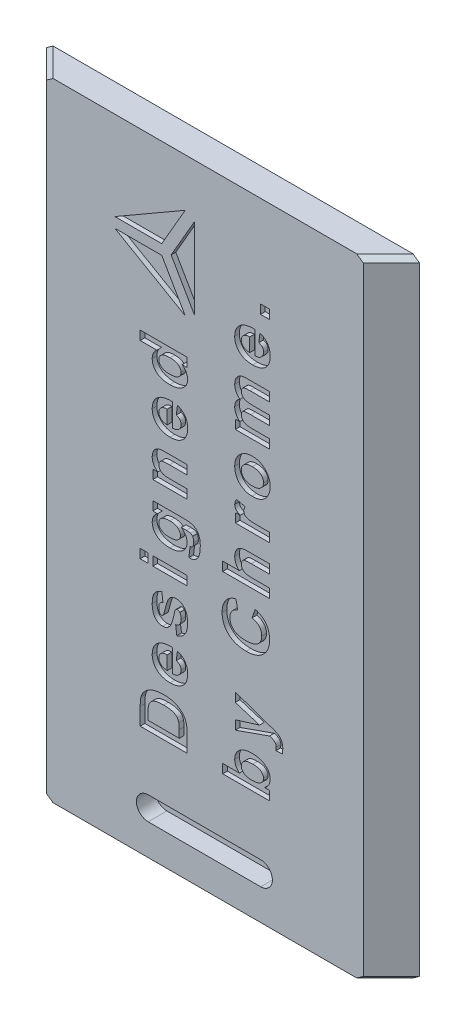
from build123d import *

# Parameters (mm, degrees)
SKETCH1_W           = 39.8
SKETCH1_H           = 66.9
BOSS_EXTRUDE1_DEPTH = 3
CUT_EXTRUDE2_DEPTH  = 68
SKETCH3_W           = 0.833333333
SKETCH3_H           = 0.961538461
SKETCH3_W_2         = 3.653846154
SKETCH3_W_3         = 0.961538462
CUT_EXTRUDE3_DEPTH  = 0.5
CUT_EXTRUDE4_DEPTH  = 2
CHAMFER3_SIZE       = 0.5
CHAMFER4_SIZE       = 0.5


with BuildPart() as part:
    # Sketch1 → Boss-Extrude1 (new body)
    with BuildSketch(Plane.XY):
        with Locations((19.9, 33.45)):
            Rectangle(SKETCH1_W, SKETCH1_H)
    extrude(amount=BOSS_EXTRUDE1_DEPTH)

    # Sketch2 → Cut-Extrude2 (cut)
    with BuildSketch(Plane.XZ):
        Polygon((0, 0), (0, 3), (3, 3), align=None)
        Polygon((39.8, 0), (39.8, 3), (36.8, 3), align=None)
    extrude(amount=-CUT_EXTRUDE2_DEPTH, mode=Mode.SUBTRACT)

    # Sketch3 → Cut-Extrude3 (cut)
    # profile 1 of 21: a face of its own
    with BuildSketch(Plane.XY.offset(3)):
        Polygon((16.3, 56.9), (18.8, 61.230127019), (18.8, 52.569872981), align=None)
    # profile 2 of 21: a face of its own
    with BuildSketch(Plane.XY.offset(3)):
        Polygon((10.3, 57.44), (15.3, 57.44), (17.8, 61.770127019), align=None)
    # profile 3 of 21: a face of its own
    with BuildSketch(Plane.XY.offset(3)):
        Polygon((10.3, 56.36), (15.3, 56.36), (17.8, 52.029872981), align=None)
    # profile 4 of 21: a face of its own
    with BuildSketch(Plane.XY.offset(3)):
        with BuildLine():
            Line((13, 11.714871266), (13, 13.548805561))
            add(Edge.make_bspline(
                [(13, 13.548805561), (12.999974034, 13.598893284), (12.999923472, 13.696425716), (13.005795538, 13.837970808), (13.011702063, 13.970333668), (13.023525636, 14.093134379), (13.035918836, 14.206798976), (13.05160956, 14.311531427), (13.071718941, 14.406670129), (13.087577593, 14.466664541), (13.095152244, 14.495319984)],
                knots=[0, 0, 0, 0, 1.259756885, 2.453039283, 3.563158368, 4.591894114, 5.55549294, 6.43918076, 7.254497783, 8, 8, 8, 8], degree=3))
            add(Edge.make_bspline(
                [(13.095152244, 14.495319984), (13.106706716, 14.531208059), (13.129645787, 14.602456581), (13.172038546, 14.705784992), (13.220512722, 14.805282496), (13.273894865, 14.901693774), (13.336044289, 14.992904721), (13.402462271, 15.081189568), (13.476513134, 15.16450358), (13.582095524, 15.271813516), (13.72854892, 15.395093442), (13.923037201, 15.523616055), (14.135959444, 15.633324434), (14.32713875, 15.707586531), (14.489797551, 15.757931673), (14.620520804, 15.790992659), (14.758289527, 15.818673122), (14.902967182, 15.841775998), (15.054343399, 15.859578281), (15.212667199, 15.872862091), (15.378084975, 15.879326319), (15.490647584, 15.880790771), (15.548076923, 15.881537933)],
                knots=[0, 0, 0, 0, 0.745533224, 1.480105594, 2.206678969, 2.934062197, 3.657537805, 4.387942524, 5.117899297, 5.860384491, 7.364627469, 8.893999443, 10.462354305, 12.093384495, 12.943538583, 13.82926703, 14.75916765, 15.722175386, 16.726416397, 17.773350261, 18.863965346, 20, 20, 20, 20], degree=3))
            add(Edge.make_bspline(
                [(15.548076923, 15.881537933), (15.647329577, 15.880150814), (15.839614426, 15.877463512), (16.116649995, 15.847182135), (16.373869379, 15.80280662), (16.534062447, 15.753308139), (16.611778846, 15.729294343)],
                knots=[0, 0, 0, 0, 1.103196498, 2.137252386, 3.096302735, 4, 4, 4, 4], degree=3))
            add(Edge.make_bspline(
                [(16.611778846, 15.729294343), (16.656355634, 15.713385171), (16.744334378, 15.681986115), (16.871390049, 15.627799908), (16.991869509, 15.568814383), (17.105466534, 15.504405701), (17.212871149, 15.435253915), (17.314057276, 15.361239051), (17.408810512, 15.282303202), (17.466544816, 15.224916695), (17.495192308, 15.196441779)],
                knots=[0, 0, 0, 0, 1.090745555, 2.152744224, 3.18177742, 4.181148221, 5.160920147, 6.124449529, 7.06936063, 8, 8, 8, 8], degree=3))
            add(Edge.make_bspline(
                [(17.495192308, 15.196441779), (17.53708161, 15.150516494), (17.623185486, 15.056116616), (17.727134641, 14.887545948), (17.822467496, 14.699656393), (17.869460992, 14.562459136), (17.893830128, 14.491313574)],
                knots=[0, 0, 0, 0, 0.911101126, 1.872777386, 2.896898885, 4, 4, 4, 4], degree=3))
            add(Edge.make_bspline(
                [(17.893830128, 14.491313574), (17.90260658, 14.462712759), (17.92082165, 14.403353247), (17.940416725, 14.309251904), (17.960419249, 14.208669626), (17.974901766, 14.10094334), (17.98571906, 13.986313289), (17.993677178, 13.864732813), (17.998686182, 13.73614647), (17.999555567, 13.647968822), (18, 13.6028921)],
                knots=[0, 0, 0, 0, 0.799100722, 1.658492201, 2.566706013, 3.539587476, 4.561478358, 5.643459719, 6.795328357, 8, 8, 8, 8], degree=3))
            Line((18, 13.6028921), (18, 11.714871266))
            Line((18, 11.714871266), (13, 11.714871266))
        make_face()
        with BuildLine():
            Line((13.833333333, 12.676409728), (17.166666667, 12.676409728))
            Line((17.166666667, 12.676409728), (17.166666667, 13.467675754))
            add(Edge.make_bspline(
                [(17.166666667, 13.467675754), (17.166383354, 13.50339934), (17.165837869, 13.572180892), (17.164235029, 13.671709558), (17.159895835, 13.763175565), (17.155401138, 13.847058068), (17.147975112, 13.923138687), (17.140671332, 13.991748463), (17.130453496, 14.052505479), (17.122387672, 14.090030505), (17.118589744, 14.107699792)],
                knots=[0, 0, 0, 0, 1.333384787, 2.567275092, 3.714769766, 4.750907381, 5.701951617, 6.567520054, 7.325492842, 8, 8, 8, 8], degree=3))
            add(Edge.make_bspline(
                [(17.118589744, 14.107699792), (17.10754658, 14.149083264), (17.086037411, 14.229687353), (17.038087282, 14.342863642), (16.980240697, 14.445273602), (16.910682666, 14.538632288), (16.822777402, 14.622767788), (16.710353463, 14.694587723), (16.576272055, 14.76105518), (16.447922616, 14.80657211), (16.333283899, 14.839244075), (16.237064794, 14.861360315), (16.132965453, 14.878838181), (16.021396717, 14.893871426), (15.902502058, 14.906018645), (15.775852129, 14.91357722), (15.641601961, 14.918735994), (15.549417637, 14.919570334), (15.502003205, 14.919999472)],
                knots=[0, 0, 0, 0, 1.038686998, 2.023088296, 2.974059649, 3.888265163, 4.839857954, 5.909819677, 7.113156087, 8.466843969, 9.20827164, 10.006482943, 10.861893492, 11.769681931, 12.739021491, 13.762258324, 14.849031541, 16, 16, 16, 16], degree=3))
            add(Edge.make_bspline(
                [(15.502003205, 14.919999472), (15.454588628, 14.919573634), (15.362737658, 14.918748708), (15.229488526, 14.913597841), (15.104832967, 14.906081743), (14.988616964, 14.893847951), (14.880679635, 14.879047963), (14.780930531, 14.86136465), (14.690021298, 14.839384135), (14.582029136, 14.80667403), (14.460582939, 14.757172594), (14.327807415, 14.689328962), (14.213839164, 14.607168336), (14.115599549, 14.515204344), (14.034443342, 14.410051489), (13.968105883, 14.292606635), (13.915233719, 14.162307577), (13.892890675, 14.06933409), (13.881410256, 14.021561972)],
                knots=[0, 0, 0, 0, 1.117823293, 2.165434315, 3.143494066, 4.061427509, 4.919678676, 5.711704341, 6.448619854, 7.123390005, 8.370176443, 9.535594722, 10.629948309, 11.671122838, 12.697675254, 13.748180153, 14.842958265, 16, 16, 16, 16], degree=3))
            add(Edge.make_bspline(
                [(13.881410256, 14.021561972), (13.87756919, 14.000890404), (13.869112631, 13.955379524), (13.859235322, 13.879858599), (13.851905514, 13.791255726), (13.844422424, 13.689119225), (13.840151312, 13.573862656), (13.835693712, 13.445003758), (13.834171005, 13.303081744), (13.833620581, 13.203920056), (13.833333333, 13.152170946)],
                knots=[0, 0, 0, 0, 0.578738571, 1.274160813, 2.095454135, 3.025967819, 4.093109015, 5.270126069, 6.575371698, 8, 8, 8, 8], degree=3))
            Line((13.833333333, 13.152170946), (13.833333333, 12.676409728))
        make_face(mode=Mode.SUBTRACT)
    # profile 5 of 21: a face of its own
    with BuildSketch(Plane.XY.offset(3)):
        with BuildLine():
            Line((16.846153846, 19.689230241), (16.974358974, 20.650768702))
            add(Edge.make_bspline(
                [(16.974358974, 20.650768702), (17.017677391, 20.635035699), (17.102850634, 20.60410126), (17.22436354, 20.547685363), (17.337764988, 20.484101957), (17.444350805, 20.415625177), (17.542084151, 20.338976236), (17.631173059, 20.255231758), (17.714086125, 20.166478542), (17.78701571, 20.06961687), (17.852542837, 19.966943897), (17.910050051, 19.858040807), (17.956292463, 19.741677089), (17.997421841, 19.62075732), (18.026583875, 19.492732859), (18.04898526, 19.359021946), (18.06208888, 19.218740018), (18.063422878, 19.123017762), (18.064102564, 19.074246266)],
                knots=[0, 0, 0, 0, 1.071107943, 2.106026551, 3.110246261, 4.091985686, 5.048484327, 5.993098568, 6.93243604, 7.868560994, 8.807385201, 9.762150055, 10.726459026, 11.715657284, 12.728568854, 13.774950884, 14.866314096, 16, 16, 16, 16], degree=3))
            add(Edge.make_bspline(
                [(18.064102564, 19.074246266), (18.062064577, 18.998053214), (18.058108146, 18.850136379), (18.030894535, 18.635620153), (17.981006861, 18.437179336), (17.914652854, 18.252889993), (17.826411632, 18.084823432), (17.721047143, 17.930435468), (17.593789706, 17.793082508), (17.496241097, 17.715220553), (17.447115385, 17.676009087)],
                knots=[0, 0, 0, 0, 1.150789362, 2.234076637, 3.257711293, 4.235652307, 5.185165037, 6.116713503, 7.051572421, 8, 8, 8, 8], degree=3))
            add(Edge.make_bspline(
                [(17.447115385, 17.676009087), (17.405235473, 17.647126698), (17.320901555, 17.588965999), (17.18425095, 17.516670113), (17.039894268, 17.454851085), (16.887418013, 17.405602155), (16.727401517, 17.364662647), (16.558828202, 17.337117989), (16.38205183, 17.321242087), (16.261584498, 17.318721441), (16.200120192, 17.317435369)],
                knots=[0, 0, 0, 0, 0.92479112, 1.862259343, 2.806490716, 3.778329015, 4.774107667, 5.808532634, 6.881879269, 8, 8, 8, 8], degree=3))
            add(Edge.make_bspline(
                [(16.200120192, 17.317435369), (16.12725916, 17.318491583), (15.984823672, 17.320556367), (15.777782204, 17.345056903), (15.581956133, 17.37952638), (15.399265519, 17.432548274), (15.227572332, 17.497528561), (15.070008876, 17.581382027), (14.922018246, 17.675654848), (14.789727959, 17.787626376), (14.670387347, 17.909222966), (14.567105432, 18.040322923), (14.477576519, 18.177713482), (14.406721363, 18.324503549), (14.349594645, 18.478176243), (14.311489235, 18.640759259), (14.286373064, 18.81037564), (14.283506986, 18.926250096), (14.282051282, 18.985103638)],
                knots=[0, 0, 0, 0, 1.22195635, 2.388793332, 3.494217055, 4.554658532, 5.576328032, 6.568651924, 7.544518331, 8.515047117, 9.469844265, 10.399052018, 11.311283086, 12.215791516, 13.128572929, 14.056648418, 15.012956531, 16, 16, 16, 16], degree=3))
            add(Edge.make_bspline(
                [(14.282051282, 18.985103638), (14.283443684, 19.050959339), (14.286168468, 19.179832042), (14.31174775, 19.367728359), (14.353354703, 19.545133371), (14.413135837, 19.711474256), (14.48811826, 19.867811565), (14.580971178, 20.013070993), (14.691022642, 20.146743364), (14.817074914, 20.269991672), (14.960503305, 20.380900788), (15.123355371, 20.474791122), (15.303024401, 20.554172004), (15.500335098, 20.618202155), (15.715774022, 20.665601811), (15.948836135, 20.69801712), (16.199483691, 20.716507581), (16.372365577, 20.715428077), (16.461538462, 20.714871266)],
                knots=[0, 0, 0, 0, 0.994896733, 1.946908626, 2.859956003, 3.744186721, 4.613079774, 5.475353993, 6.343074053, 7.224463735, 8.134843929, 9.075595858, 10.058286387, 11.098708908, 12.205400254, 13.387874146, 14.652659326, 16, 16, 16, 16], degree=3))
            Line((16.461538462, 20.714871266), (16.461538462, 18.27897383))
            add(Edge.make_bspline(
                [(16.461538462, 18.27897383), (16.495954385, 18.280550746), (16.562973228, 18.283621507), (16.660936668, 18.295253283), (16.752634973, 18.315389873), (16.838624466, 18.34174215), (16.918965486, 18.373077572), (16.992886559, 18.41293871), (17.06133072, 18.458863865), (17.123181848, 18.511956239), (17.178087462, 18.570088057), (17.226339094, 18.631430215), (17.268531316, 18.695888556), (17.300621193, 18.765128407), (17.327717475, 18.836847749), (17.3450858, 18.912337673), (17.356627017, 18.991092902), (17.358181202, 19.044822752), (17.358974359, 19.072243061)],
                knots=[0, 0, 0, 0, 1.231756261, 2.398624542, 3.522625857, 4.583815436, 5.612473245, 6.600564899, 7.580690863, 8.554470542, 9.508734211, 10.435415665, 11.342824763, 12.255949018, 13.158633635, 14.07945191, 15.019874036, 16, 16, 16, 16], degree=3))
            add(Edge.make_bspline(
                [(17.358974359, 19.072243061), (17.357326684, 19.108726625), (17.354135383, 19.179389843), (17.332549462, 19.281582613), (17.292311895, 19.373516528), (17.238717749, 19.457817355), (17.167018169, 19.532112466), (17.076606525, 19.595444165), (16.96863115, 19.649826461), (16.888322884, 19.675663486), (16.846153846, 19.689230241)],
                knots=[0, 0, 0, 0, 1.004921032, 1.946382099, 2.856706549, 3.754452914, 4.684394026, 5.679508242, 6.781533818, 8, 8, 8, 8], degree=3))
        make_face()
        with BuildLine():
            add(Edge.make_bspline(
                [(15.884615385, 19.753332805), (15.849204717, 19.751679325), (15.780239969, 19.748459057), (15.679698611, 19.737926694), (15.58595348, 19.719946096), (15.498348531, 19.69589662), (15.41804395, 19.664974873), (15.343456995, 19.628873199), (15.27624917, 19.585388043), (15.215360831, 19.536826617), (15.161906991, 19.48288705), (15.114911135, 19.426468926), (15.075710291, 19.366794618), (15.042834727, 19.304990402), (15.018050103, 19.239644143), (14.999723417, 19.171582873), (14.989925809, 19.100568426), (14.988105051, 19.052571361), (14.987179487, 19.028172548)],
                knots=[0, 0, 0, 0, 1.316843738, 2.564645129, 3.751729234, 4.859162073, 5.934884982, 6.944432334, 7.931870412, 8.902336615, 9.831997632, 10.748324706, 11.625538792, 12.479920341, 13.343703281, 14.216169456, 15.093208151, 16, 16, 16, 16], degree=3))
            add(Edge.make_bspline(
                [(14.987179487, 19.028172548), (14.988025882, 19.002097787), (14.989693745, 18.950716167), (15.000576245, 18.875366551), (15.019878256, 18.803946152), (15.046002551, 18.735910671), (15.080405512, 18.671405911), (15.1225965, 18.610430429), (15.172047289, 18.552754832), (15.209511667, 18.518002642), (15.228565705, 18.500327997)],
                knots=[0, 0, 0, 0, 1.043516863, 2.056302107, 3.038302912, 3.998520634, 4.966791607, 5.956307719, 6.960596886, 8, 8, 8, 8], degree=3))
            add(Edge.make_bspline(
                [(15.228565705, 18.500327997), (15.2492802, 18.483854041), (15.290898201, 18.45075581), (15.359902503, 18.408777494), (15.43366002, 18.372211465), (15.514162133, 18.344961827), (15.598799942, 18.321031116), (15.689596184, 18.306993509), (15.785251853, 18.29753714), (15.850868645, 18.296522767), (15.884615385, 18.296001074)],
                knots=[0, 0, 0, 0, 0.903873942, 1.815995408, 2.755131859, 3.711650387, 4.716574161, 5.757841734, 6.846857195, 8, 8, 8, 8], degree=3))
            Line((15.884615385, 18.296001074), (15.884615385, 19.753332805))
        make_face(mode=Mode.SUBTRACT)
    # profile 6 of 21: a face of its own
    with BuildSketch(Plane.XY.offset(3)):
        with BuildLine():
            Line((16.91025641, 22.022563574), (16.782051282, 22.984102036))
            add(Edge.make_bspline(
                [(16.782051282, 22.984102036), (16.826947718, 22.995660465), (16.913429467, 23.017924887), (17.030974688, 23.073854277), (17.131978873, 23.145114787), (17.21561262, 23.233616949), (17.281061479, 23.34063081), (17.326534907, 23.466246627), (17.354861911, 23.610183029), (17.357555084, 23.712456526), (17.358974359, 23.766353638)],
                knots=[0, 0, 0, 0, 1.03977575, 2.002867763, 2.906350581, 3.803237518, 4.719339767, 5.704501652, 6.79029527, 8, 8, 8, 8], degree=3))
            add(Edge.make_bspline(
                [(17.358974359, 23.766353638), (17.357760826, 23.825241669), (17.355479458, 23.935947527), (17.330482217, 24.090095635), (17.290861789, 24.223097377), (17.245957761, 24.296571882), (17.224759615, 24.331257484)],
                knots=[0, 0, 0, 0, 1.198129151, 2.252408761, 3.175002897, 4, 4, 4, 4], degree=3))
            add(Edge.make_bspline(
                [(17.224759615, 24.331257484), (17.208713064, 24.351023915), (17.177505902, 24.389465458), (17.114717537, 24.428475608), (17.045799979, 24.454441879), (16.996645205, 24.457095614), (16.971354167, 24.45846101)],
                knots=[0, 0, 0, 0, 1.030872991, 2.004830756, 2.973448591, 4, 4, 4, 4], degree=3))
            add(Edge.make_bspline(
                [(16.971354167, 24.45846101), (16.954238852, 24.457806499), (16.920808467, 24.45652808), (16.873001557, 24.443150893), (16.829792781, 24.420698531), (16.805395219, 24.399872372), (16.79306891, 24.389350433)],
                knots=[0, 0, 0, 0, 1.045349703, 2.041822997, 3.010676005, 4, 4, 4, 4], degree=3))
            add(Edge.make_bspline(
                [(16.79306891, 24.389350433), (16.781397592, 24.374042428), (16.754352924, 24.338570863), (16.725789527, 24.266529416), (16.69427893, 24.174982646), (16.677863433, 24.105112702), (16.668870192, 24.066834407)],
                knots=[0, 0, 0, 0, 0.660501868, 1.530508677, 2.647087544, 4, 4, 4, 4], degree=3))
            add(Edge.make_bspline(
                [(16.668870192, 24.066834407), (16.648571097, 23.973593825), (16.609926058, 23.796084143), (16.548444461, 23.543713816), (16.488933043, 23.318220324), (16.43092831, 23.119039503), (16.374904929, 22.946860924), (16.318288447, 22.801672279), (16.265515757, 22.681996499), (16.224431334, 22.614520547), (16.206129808, 22.584462613)],
                knots=[0, 0, 0, 0, 1.469089687, 2.796825535, 3.998745421, 5.059265209, 5.990657066, 6.784841839, 7.458693894, 8, 8, 8, 8], degree=3))
            add(Edge.make_bspline(
                [(16.206129808, 22.584462613), (16.181134364, 22.550172423), (16.13233161, 22.483221991), (16.048299481, 22.394044463), (15.956933705, 22.318428532), (15.857951773, 22.256602758), (15.751590703, 22.209413134), (15.638344167, 22.174906769), (15.517732775, 22.154924944), (15.434968516, 22.152170928), (15.392828526, 22.150768702)],
                knots=[0, 0, 0, 0, 1.056974227, 2.063706289, 3.045111424, 4.005796011, 4.963194591, 5.937303459, 6.949763919, 8, 8, 8, 8], degree=3))
            add(Edge.make_bspline(
                [(15.392828526, 22.150768702), (15.354376606, 22.151995205), (15.278428472, 22.154417726), (15.167096362, 22.171444166), (15.060598912, 22.200853622), (14.958743898, 22.242201939), (14.861538168, 22.29563881), (14.76853518, 22.360052988), (14.681540283, 22.436937531), (14.5985553, 22.524186829), (14.523561915, 22.624418475), (14.457831221, 22.737454747), (14.404105539, 22.864303936), (14.359463218, 23.00312108), (14.324262919, 23.154871237), (14.299859936, 23.319318291), (14.284691983, 23.49663725), (14.282949621, 23.61908601), (14.282051282, 23.682219023)],
                knots=[0, 0, 0, 0, 0.866467056, 1.711398476, 2.531025161, 3.351204248, 4.182899032, 5.026153667, 5.89536065, 6.794911284, 7.735444051, 8.709799683, 9.7343434, 10.83365844, 11.992614653, 13.240848695, 14.577416907, 16, 16, 16, 16], degree=3))
            add(Edge.make_bspline(
                [(14.282051282, 23.682219023), (14.282766161, 23.742338168), (14.284153756, 23.859030658), (14.296336935, 24.027863085), (14.315527488, 24.184936559), (14.34517804, 24.329599111), (14.38028889, 24.46287389), (14.424443188, 24.584471176), (14.477309103, 24.693457456), (14.53816047, 24.791754601), (14.608354754, 24.878893422), (14.684565221, 24.959904944), (14.769640692, 25.032953668), (14.861195517, 25.100791024), (14.962619569, 25.158129776), (15.069998416, 25.210788367), (15.185572155, 25.25608395), (15.266425122, 25.279726987), (15.307692308, 25.291794343)],
                knots=[0, 0, 0, 0, 1.380360088, 2.679307166, 3.885113103, 5.011294146, 6.067668824, 7.047577368, 7.976808132, 8.844746588, 9.6960693, 10.542058856, 11.395278188, 12.26784334, 13.154143679, 14.066232085, 15.013008876, 16, 16, 16, 16], degree=3))
            Line((15.307692308, 25.291794343), (15.435897436, 24.330255882))
            add(Edge.make_bspline(
                [(15.435897436, 24.330255882), (15.401420169, 24.320729351), (15.334490621, 24.302235821), (15.243827136, 24.256172133), (15.164952723, 24.199769485), (15.09944187, 24.130434475), (15.047675972, 24.046546396), (15.012725049, 23.946861982), (14.990225283, 23.832122908), (14.988232993, 23.750448046), (14.987179487, 23.707259087)],
                knots=[0, 0, 0, 0, 1.018088462, 1.976380579, 2.883123771, 3.772444965, 4.678988082, 5.673279403, 6.769650299, 8, 8, 8, 8], degree=3))
            add(Edge.make_bspline(
                [(14.987179487, 23.707259087), (14.988499822, 23.653763755), (14.990952257, 23.554399667), (15.008979415, 23.417455239), (15.039858982, 23.303291594), (15.075166739, 23.24100816), (15.091346154, 23.21246742)],
                knots=[0, 0, 0, 0, 1.253094045, 2.327540427, 3.233612691, 4, 4, 4, 4], degree=3))
            add(Edge.make_bspline(
                [(15.091346154, 23.21246742), (15.104014086, 23.197057135), (15.128323131, 23.16748567), (15.175431683, 23.135559382), (15.227637239, 23.115281029), (15.264769707, 23.113309704), (15.283653846, 23.112307164)],
                knots=[0, 0, 0, 0, 1.057832138, 2.029920023, 2.998093444, 4, 4, 4, 4], degree=3))
            add(Edge.make_bspline(
                [(15.283653846, 23.112307164), (15.299830517, 23.113525615), (15.332093737, 23.115955728), (15.378410529, 23.133890043), (15.420759885, 23.163836026), (15.443183609, 23.191150454), (15.454927885, 23.205456202)],
                knots=[0, 0, 0, 0, 0.958252903, 1.911167308, 2.905987877, 4, 4, 4, 4], degree=3))
            add(Edge.make_bspline(
                [(15.454927885, 23.205456202), (15.463644182, 23.218945937), (15.484468759, 23.251174989), (15.509715186, 23.313238405), (15.538822, 23.393801048), (15.570232953, 23.493918582), (15.60570038, 23.612829183), (15.64100494, 23.751806203), (15.68013407, 23.909711301), (15.720558134, 24.081964414), (15.762043638, 24.257353347), (15.809272433, 24.423282167), (15.858193456, 24.575487689), (15.909800676, 24.713300417), (15.964203623, 24.837248443), (16.019524586, 24.947602256), (16.078209726, 25.044038207), (16.122772737, 25.099888082), (16.144030449, 25.12652992)],
                knots=[0, 0, 0, 0, 0.374470902, 0.894668607, 1.558240068, 2.377002728, 3.344280683, 4.45643205, 5.72551034, 7.144099038, 8.589083829, 9.934452683, 11.172410737, 12.322411392, 13.369942356, 14.332493707, 15.20455626, 16, 16, 16, 16], degree=3))
            add(Edge.make_bspline(
                [(16.144030449, 25.12652992), (16.165806035, 25.150195674), (16.208832991, 25.196957461), (16.283541795, 25.255846239), (16.362589461, 25.308050225), (16.449328683, 25.348469186), (16.541486792, 25.381064724), (16.640185748, 25.404163511), (16.745336709, 25.416685793), (16.817410239, 25.418880304), (16.854166667, 25.419999472)],
                knots=[0, 0, 0, 0, 0.971012965, 1.9186502, 2.868006896, 3.82989672, 4.803792202, 5.820095146, 6.888280979, 8, 8, 8, 8], degree=3))
            add(Edge.make_bspline(
                [(16.854166667, 25.419999472), (16.89496213, 25.418508193), (16.975328547, 25.415570398), (17.093891598, 25.396533513), (17.207402798, 25.362641119), (17.317581659, 25.31804488), (17.422287158, 25.257856837), (17.522528568, 25.185191485), (17.619478414, 25.100729798), (17.710443207, 25.002632161), (17.793514241, 24.89128754), (17.867098589, 24.767750685), (17.928152503, 24.631104634), (17.978145033, 24.482128808), (18.016719439, 24.320510003), (18.044861102, 24.14646387), (18.060320301, 23.959943249), (18.062817143, 23.83148485), (18.064102564, 23.765352036)],
                knots=[0, 0, 0, 0, 0.853005228, 1.680406763, 2.502135431, 3.325285981, 4.159928718, 5.020072903, 5.910500533, 6.844018396, 7.811498054, 8.809909951, 9.84399402, 10.934451331, 12.090792638, 13.314110396, 14.617253208, 16, 16, 16, 16], degree=3))
            add(Edge.make_bspline(
                [(18.064102564, 23.765352036), (18.063053107, 23.704903802), (18.061009236, 23.587177788), (18.047708589, 23.415362272), (18.021626876, 23.253757304), (17.990030728, 23.100880164), (17.945316058, 22.958466123), (17.892371755, 22.825199766), (17.829387932, 22.701524282), (17.755947367, 22.588215745), (17.67435129, 22.484694035), (17.585979356, 22.390091658), (17.490827492, 22.304893416), (17.388723346, 22.228876598), (17.279180627, 22.162886476), (17.162976921, 22.10578211), (17.039665283, 22.05794435), (16.953897489, 22.034495176), (16.91025641, 22.022563574)],
                knots=[0, 0, 0, 0, 1.275882977, 2.484847063, 3.632911253, 4.72891361, 5.776434669, 6.778732445, 7.752511816, 8.700454148, 9.62377315, 10.531089817, 11.429331714, 12.315777555, 13.213660083, 14.124390551, 15.045636884, 16, 16, 16, 16], degree=3))
        make_face()
    # profile 7 of 21: a face of its own
    with BuildSketch(Plane.XY.offset(3)):
        with Locations((13.416666666, 27.657178959)):
            Rectangle(SKETCH3_W, SKETCH3_H)
    # profile 8 of 21: a face of its own
    with BuildSketch(Plane.XY.offset(3)):
        with Locations((16.173076923, 27.657178959)):
            Rectangle(SKETCH3_W_2, SKETCH3_H)
    # profile 9 of 21: a face of its own
    with BuildSketch(Plane.XY.offset(3)):
        with BuildLine():
            Line((18.192307692, 29.894358446), (18.320512821, 30.984102036))
            add(Edge.make_bspline(
                [(18.320512821, 30.984102036), (18.351797959, 30.988803931), (18.409977029, 30.997547759), (18.487852637, 31.023881567), (18.551900705, 31.056718343), (18.582581523, 31.088434222), (18.596955128, 31.103292741)],
                knots=[0, 0, 0, 0, 1.230992451, 2.289201876, 3.198511091, 4, 4, 4, 4], degree=3))
            add(Edge.make_bspline(
                [(18.596955128, 31.103292741), (18.613789565, 31.127383698), (18.64945894, 31.178428434), (18.682052535, 31.273786057), (18.701630515, 31.386240825), (18.703907942, 31.467438582), (18.705128205, 31.510944984)],
                knots=[0, 0, 0, 0, 0.817912222, 1.733020108, 2.785334205, 4, 4, 4, 4], degree=3))
            add(Edge.make_bspline(
                [(18.705128205, 31.510944984), (18.70401388, 31.566467004), (18.701923553, 31.670618948), (18.680817343, 31.815698823), (18.648330402, 31.94062976), (18.610587655, 32.010938848), (18.592948718, 32.043797548)],
                knots=[0, 0, 0, 0, 1.20845169, 2.266895082, 3.190039628, 4, 4, 4, 4], degree=3))
            add(Edge.make_bspline(
                [(18.592948718, 32.043797548), (18.579259351, 32.063062419), (18.551432108, 32.102223337), (18.495796749, 32.151726157), (18.428730102, 32.193020882), (18.37862084, 32.213458487), (18.352564103, 32.22408601)],
                knots=[0, 0, 0, 0, 0.924769886, 1.87983818, 2.897519225, 4, 4, 4, 4], degree=3))
            add(Edge.make_bspline(
                [(18.352564103, 32.22408601), (18.328963016, 32.230570566), (18.273783115, 32.245731612), (18.176651121, 32.258321904), (18.054505989, 32.264175979), (17.96495328, 32.26545321), (17.915865385, 32.266153318)],
                knots=[0, 0, 0, 0, 0.666655715, 1.558656893, 2.661789295, 4, 4, 4, 4], degree=3))
            Line((17.915865385, 32.266153318), (17.390024038, 32.266153318))
            add(Edge.make_bspline(
                [(17.390024038, 32.266153318), (17.438546778, 32.227998755), (17.532381776, 32.154214107), (17.656710777, 32.031516746), (17.76292105, 31.90422232), (17.849620145, 31.770816962), (17.916560052, 31.631680725), (17.965288126, 31.487906066), (17.993831206, 31.338121641), (17.997931589, 31.236623969), (18, 31.185424151)],
                knots=[0, 0, 0, 0, 1.14820102, 2.220431895, 3.244469247, 4.228720426, 5.173737733, 6.111123218, 7.047168801, 8, 8, 8, 8], degree=3))
            add(Edge.make_bspline(
                [(18, 31.185424151), (17.998098666, 31.12886664), (17.994371119, 31.017986152), (17.964378826, 30.856453883), (17.916596308, 30.703554967), (17.847461012, 30.560319126), (17.759877119, 30.426041888), (17.651771593, 30.301880147), (17.525297946, 30.185850175), (17.429262802, 30.118966454), (17.380008013, 30.084662933)],
                knots=[0, 0, 0, 0, 1.026582672, 2.012606019, 2.973395795, 3.92810037, 4.891813419, 5.87641867, 6.910851312, 8, 8, 8, 8], degree=3))
            add(Edge.make_bspline(
                [(17.380008013, 30.084662933), (17.338402589, 30.058788734), (17.254917865, 30.006870013), (17.12004088, 29.943503455), (16.979184937, 29.88776283), (16.829745808, 29.844270265), (16.673595834, 29.808985325), (16.509587305, 29.784224807), (16.338301795, 29.768899809), (16.221520671, 29.76707994), (16.162059295, 29.766153318)],
                knots=[0, 0, 0, 0, 0.920413347, 1.846885479, 2.796895544, 3.766080589, 4.769638637, 5.804757267, 6.882249555, 8, 8, 8, 8], degree=3))
            add(Edge.make_bspline(
                [(16.162059295, 29.766153318), (16.087907227, 29.767622699), (15.944024748, 29.770473844), (15.734995362, 29.78890256), (15.540005621, 29.822462725), (15.35759158, 29.866515842), (15.189190546, 29.926016895), (15.033206177, 29.996860165), (14.891685982, 30.082318014), (14.76408029, 30.179787255), (14.650953104, 30.286910596), (14.552470349, 30.401481157), (14.468023712, 30.522057811), (14.401415734, 30.650240126), (14.347229141, 30.783428774), (14.309182541, 30.923257068), (14.286957564, 31.069861527), (14.283706835, 31.169656174), (14.282051282, 31.220480241)],
                knots=[0, 0, 0, 0, 1.332485035, 2.58551454, 3.766077873, 4.884989595, 5.953201604, 6.970539836, 7.958242657, 8.91695213, 9.850556154, 10.752434161, 11.627762942, 12.489186699, 13.342529871, 14.207019017, 15.086858986, 16, 16, 16, 16], degree=3))
            add(Edge.make_bspline(
                [(14.282051282, 31.220480241), (14.283849917, 31.272658759), (14.287389543, 31.375343527), (14.313391696, 31.525812891), (14.359635382, 31.668373783), (14.421295981, 31.804076846), (14.502108528, 31.931866616), (14.599646237, 32.052417434), (14.715792601, 32.165598941), (14.803776535, 32.232036226), (14.848958333, 32.266153318)],
                knots=[0, 0, 0, 0, 1.010510608, 1.988635389, 2.945777154, 3.906473309, 4.868213653, 5.866063748, 6.904174068, 8, 8, 8, 8], degree=3))
            Line((14.848958333, 32.266153318), (14.346153846, 32.266153318))
            Line((14.346153846, 32.266153318), (14.346153846, 33.227691779))
            Line((14.346153846, 33.227691779), (17.578325321, 33.227691779))
            add(Edge.make_bspline(
                [(17.578325321, 33.227691779), (17.629738236, 33.227089836), (17.729240054, 33.225924867), (17.873618524, 33.223162611), (18.008076887, 33.212900695), (18.132549686, 33.203355037), (18.246558915, 33.187145341), (18.350964021, 33.171685348), (18.444885742, 33.148829095), (18.55537542, 33.118033034), (18.678521112, 33.070106806), (18.812265548, 33.003629872), (18.928453857, 32.9251037), (19.029026515, 32.835225413), (19.115282099, 32.731901545), (19.190935292, 32.614025366), (19.25679548, 32.480683808), (19.311744788, 32.330483003), (19.357374019, 32.163190082), (19.38843017, 31.975654475), (19.407466726, 31.767753776), (19.409298216, 31.622168221), (19.41025641, 31.546001074)],
                knots=[0, 0, 0, 0, 1.057587057, 2.046797663, 2.969031255, 3.830707079, 4.613469948, 5.337102451, 6.000031029, 6.599929791, 7.695405313, 8.711910746, 9.666109128, 10.570556896, 11.477035671, 12.425583754, 13.445146213, 14.529350733, 15.710392375, 17.006394585, 18.43381176, 20, 20, 20, 20], degree=3))
            add(Edge.make_bspline(
                [(19.41025641, 31.546001074), (19.40924292, 31.473534095), (19.4072933, 31.334131605), (19.39395781, 31.13301865), (19.368793942, 30.948777931), (19.335351612, 30.780183212), (19.291538626, 30.628031518), (19.239013042, 30.491139173), (19.175026291, 30.371333384), (19.100943873, 30.268162031), (19.020135722, 30.179236372), (18.93341531, 30.102862652), (18.842153481, 30.037101429), (18.745318029, 29.983661883), (18.643459079, 29.942174405), (18.536103674, 29.913383672), (18.423667707, 29.894600917), (18.346631105, 29.892447633), (18.307491987, 29.891353638)],
                knots=[0, 0, 0, 0, 1.548916259, 2.979602395, 4.304684765, 5.520838955, 6.650036986, 7.684973916, 8.649175094, 9.544248639, 10.392919075, 11.211909474, 12.009926509, 12.792446592, 13.570299937, 14.35451013, 15.163994516, 16, 16, 16, 16], degree=3))
            add(Edge.make_bspline(
                [(18.307491987, 29.891353638), (18.289795614, 29.891632962), (18.251390742, 29.892239154), (18.213005569, 29.893616019), (18.192307692, 29.894358446)],
                knots=[0, 0, 0, 0, 0.921569154, 2, 2, 2, 2], degree=3))
        make_face()
        with BuildLine():
            add(Edge.make_bspline(
                [(16.127003205, 30.727691779), (16.17576533, 30.728157358), (16.270062721, 30.729057705), (16.406530641, 30.739084563), (16.532609754, 30.755973343), (16.648839927, 30.778825272), (16.755012586, 30.808185839), (16.850881428, 30.845937588), (16.937656383, 30.888028237), (17.013212723, 30.939003687), (17.079274944, 30.994105922), (17.136984244, 31.052254102), (17.185260169, 31.114016297), (17.226109996, 31.17789253), (17.256318131, 31.246327881), (17.277934542, 31.317312746), (17.29327951, 31.391440164), (17.294334592, 31.442088235), (17.294871795, 31.467876074)],
                knots=[0, 0, 0, 0, 1.512566013, 2.925037165, 4.241951947, 5.456694731, 6.597752419, 7.653745747, 8.649663045, 9.583307458, 10.473179209, 11.315483628, 12.119469364, 12.901195816, 13.661563954, 14.43146686, 15.201369766, 16, 16, 16, 16], degree=3))
            add(Edge.make_bspline(
                [(17.294871795, 31.467876074), (17.294321405, 31.495330355), (17.29323314, 31.549614712), (17.277918414, 31.629011878), (17.256888557, 31.705888853), (17.223599701, 31.77818034), (17.183764282, 31.848413716), (17.13281271, 31.914005536), (17.074787456, 31.978060961), (17.006337685, 32.036435857), (16.930252204, 32.091237097), (16.844331636, 32.138123018), (16.750150916, 32.178325316), (16.646839002, 32.209785415), (16.535591019, 32.236277157), (16.415276873, 32.253846975), (16.286418286, 32.263505531), (16.197799571, 32.265251715), (16.152043269, 32.266153318)],
                knots=[0, 0, 0, 0, 0.842743878, 1.666326953, 2.478507952, 3.28730864, 4.106015362, 4.955980401, 5.835016076, 6.759165438, 7.716195361, 8.713237685, 9.761892833, 10.859256999, 12.029530086, 13.27512998, 14.593073992, 16, 16, 16, 16], degree=3))
            add(Edge.make_bspline(
                [(16.152043269, 32.266153318), (16.104272299, 32.26581914), (16.011929091, 32.265173161), (15.878238403, 32.253366103), (15.753727119, 32.236896093), (15.638249963, 32.213515675), (15.53294015, 32.181128631), (15.436820806, 32.14322419), (15.350144956, 32.098457794), (15.273824371, 32.045809751), (15.206374525, 31.988714093), (15.148177291, 31.927419287), (15.098200499, 31.862967281), (15.058157899, 31.794038319), (15.025421294, 31.722159227), (15.003951197, 31.645761839), (14.988788812, 31.566302586), (14.987722167, 31.511688058), (14.987179487, 31.483901715)],
                knots=[0, 0, 0, 0, 1.455540256, 2.81361788, 4.08729056, 5.282785967, 6.399824453, 7.441051004, 8.42878758, 9.365897553, 10.261070599, 11.11764001, 11.937895352, 12.740732438, 13.542536936, 14.337922486, 15.1543815, 16, 16, 16, 16], degree=3))
            add(Edge.make_bspline(
                [(14.987179487, 31.483901715), (14.987754891, 31.457123258), (14.988892498, 31.404180664), (15.003781579, 31.326948648), (15.025976445, 31.253145356), (15.055644037, 31.182188139), (15.096491233, 31.116187682), (15.145091162, 31.053329915), (15.202443848, 30.994116544), (15.268855611, 30.93899519), (15.343997725, 30.888563559), (15.429070189, 30.845834848), (15.5227282, 30.808372739), (15.625847735, 30.778905372), (15.738077571, 30.756036647), (15.859474254, 30.739053966), (15.990283093, 30.729105671), (16.080578213, 30.728171883), (16.127003205, 30.727691779)],
                knots=[0, 0, 0, 0, 0.836481082, 1.653772601, 2.449976146, 3.245288891, 4.051226255, 4.870050842, 5.726756189, 6.623940248, 7.565256659, 8.550720986, 9.595957226, 10.716278907, 11.900071203, 13.176080532, 14.548089411, 16, 16, 16, 16], degree=3))
        make_face(mode=Mode.SUBTRACT)
    # profile 10 of 21: a face of its own
    with BuildSketch(Plane.XY.offset(3)):
        with BuildLine():
            Line((18, 38.381537933), (18, 37.419999472))
            Line((18, 37.419999472), (16.125, 37.419999472))
            add(Edge.make_bspline(
                [(16.125, 37.419999472), (16.077587953, 37.419858845), (15.987093821, 37.419590434), (15.857891289, 37.416190715), (15.741991767, 37.412712454), (15.639123584, 37.406688724), (15.549558887, 37.399046835), (15.472664682, 37.389163), (15.409093389, 37.377550378), (15.34277687, 37.3606651), (15.272815655, 37.333359758), (15.199532051, 37.291092054), (15.134729961, 37.240679058), (15.081912425, 37.180077561), (15.038936707, 37.112405453), (15.009022448, 37.037332565), (14.990291027, 36.955836382), (14.988237728, 36.899272082), (14.987179487, 36.870119664)],
                knots=[0, 0, 0, 0, 1.584493052, 3.024280373, 4.319392181, 5.459488321, 6.467679107, 7.323005985, 8.049570451, 8.626025587, 9.608194156, 10.547930895, 11.445379944, 12.338657376, 13.220996304, 14.11197102, 15.026937278, 16, 16, 16, 16], degree=3))
            add(Edge.make_bspline(
                [(14.987179487, 36.870119664), (14.988905284, 36.832563051), (14.992307437, 36.758525746), (15.019697097, 36.650647049), (15.062748513, 36.548617713), (15.123318048, 36.454421763), (15.197721419, 36.370500252), (15.285630017, 36.300657903), (15.38348521, 36.243736956), (15.475378107, 36.209262948), (15.558619746, 36.188543979), (15.633833951, 36.174483102), (15.721586931, 36.164398141), (15.820998691, 36.153750967), (15.933000661, 36.147744058), (16.056485492, 36.141041991), (16.192432286, 36.138574356), (16.286926141, 36.138163192), (16.336338141, 36.137948189)],
                knots=[0, 0, 0, 0, 1.032566677, 2.035552408, 3.044331183, 4.069139801, 5.103993993, 6.117241679, 7.146531659, 8.208133594, 8.805465577, 9.506599874, 10.312470975, 11.236026688, 12.25811227, 13.398971111, 14.639889977, 16, 16, 16, 16], degree=3))
            Line((16.336338141, 36.137948189), (18, 36.137948189))
            Line((18, 36.137948189), (18, 35.176409728))
            Line((18, 35.176409728), (14.346153846, 35.176409728))
            Line((14.346153846, 35.176409728), (14.346153846, 36.137948189))
            Line((14.346153846, 36.137948189), (14.872996795, 36.137948189))
            add(Edge.make_bspline(
                [(14.872996795, 36.137948189), (14.826148002, 36.175116982), (14.734882294, 36.247525169), (14.613745511, 36.368843583), (14.510464364, 36.496841681), (14.428141242, 36.633916843), (14.361540963, 36.776854696), (14.316296981, 36.928052938), (14.286626014, 37.085970917), (14.28359421, 37.193832933), (14.282051282, 37.248725433)],
                knots=[0, 0, 0, 0, 1.096351489, 2.135792388, 3.138267738, 4.105721302, 5.062255615, 6.023231078, 6.993994435, 8, 8, 8, 8], degree=3))
            add(Edge.make_bspline(
                [(14.282051282, 37.248725433), (14.283231068, 37.296902182), (14.285554408, 37.391776187), (14.308882042, 37.530245361), (14.343153625, 37.663039069), (14.393806098, 37.787057601), (14.453160577, 37.901843522), (14.524519472, 38.00114096), (14.600326434, 38.088499148), (14.687058902, 38.158804299), (14.780275629, 38.216833479), (14.878651716, 38.266408458), (14.983463481, 38.305479678), (15.097195846, 38.335327713), (15.226390256, 38.355713424), (15.376113826, 38.37167944), (15.550322145, 38.379996948), (15.674271757, 38.381001904), (15.740384615, 38.381537933)],
                knots=[0, 0, 0, 0, 1.087198529, 2.141009522, 3.163542844, 4.178792496, 5.160466844, 6.074805919, 6.934654979, 7.765030839, 8.585173683, 9.411430249, 10.24903402, 11.106896671, 12.062742222, 13.200321845, 14.506693772, 16, 16, 16, 16], degree=3))
            Line((15.740384615, 38.381537933), (18, 38.381537933))
        make_face()
    # profile 11 of 21: a face of its own
    with BuildSketch(Plane.XY.offset(3)):
        with BuildLine():
            Line((16.846153846, 42.381537933), (16.974358974, 43.343076395))
            add(Edge.make_bspline(
                [(16.974358974, 43.343076395), (17.017677391, 43.327343391), (17.102850634, 43.296408952), (17.22436354, 43.239993055), (17.337764988, 43.17640965), (17.444350805, 43.107932869), (17.542084151, 43.031283928), (17.631173059, 42.94753945), (17.714086125, 42.858786234), (17.78701571, 42.761924562), (17.852542837, 42.659251589), (17.910050051, 42.5503485), (17.956292463, 42.433984781), (17.997421841, 42.313065012), (18.026583875, 42.185040551), (18.04898526, 42.051329638), (18.06208888, 41.91104771), (18.063422878, 41.815325454), (18.064102564, 41.766553959)],
                knots=[0, 0, 0, 0, 1.071107943, 2.106026551, 3.110246261, 4.091985686, 5.048484327, 5.993098568, 6.93243604, 7.868560994, 8.807385201, 9.762150055, 10.726459026, 11.715657284, 12.728568854, 13.774950884, 14.866314096, 16, 16, 16, 16], degree=3))
            add(Edge.make_bspline(
                [(18.064102564, 41.766553959), (18.062064577, 41.690360906), (18.058108146, 41.542444072), (18.030894535, 41.327927845), (17.981006861, 41.129487029), (17.914652854, 40.945197685), (17.826411632, 40.777131124), (17.721047143, 40.622743161), (17.593789706, 40.4853902), (17.496241097, 40.407528246), (17.447115385, 40.368316779)],
                knots=[0, 0, 0, 0, 1.150789362, 2.234076637, 3.257711293, 4.235652307, 5.185165037, 6.116713503, 7.051572421, 8, 8, 8, 8], degree=3))
            add(Edge.make_bspline(
                [(17.447115385, 40.368316779), (17.405235473, 40.339434391), (17.320901555, 40.281273691), (17.18425095, 40.208977805), (17.039894268, 40.147158777), (16.887418013, 40.097909847), (16.727401517, 40.056970339), (16.558828202, 40.029425681), (16.38205183, 40.013549779), (16.261584498, 40.011029134), (16.200120192, 40.009743061)],
                knots=[0, 0, 0, 0, 0.92479112, 1.862259343, 2.806490716, 3.778329015, 4.774107667, 5.808532634, 6.881879269, 8, 8, 8, 8], degree=3))
            add(Edge.make_bspline(
                [(16.200120192, 40.009743061), (16.12725916, 40.010799275), (15.984823672, 40.012864059), (15.777782204, 40.037364596), (15.581956133, 40.071834072), (15.399265519, 40.124855966), (15.227572332, 40.189836254), (15.070008876, 40.27368972), (14.922018246, 40.36796254), (14.789727959, 40.479934069), (14.670387347, 40.601530659), (14.567105432, 40.732630615), (14.477576519, 40.870021174), (14.406721363, 41.016811241), (14.349594645, 41.170483936), (14.311489235, 41.333066951), (14.286373064, 41.502683332), (14.283506986, 41.618557788), (14.282051282, 41.67741133)],
                knots=[0, 0, 0, 0, 1.22195635, 2.388793332, 3.494217055, 4.554658532, 5.576328032, 6.568651924, 7.544518331, 8.515047117, 9.469844265, 10.399052018, 11.311283086, 12.215791516, 13.128572929, 14.056648418, 15.012956531, 16, 16, 16, 16], degree=3))
            add(Edge.make_bspline(
                [(14.282051282, 41.67741133), (14.283443684, 41.743267031), (14.286168468, 41.872139734), (14.31174775, 42.060036051), (14.353354703, 42.237441063), (14.413135837, 42.403781948), (14.48811826, 42.560119257), (14.580971178, 42.705378685), (14.691022642, 42.839051056), (14.817074914, 42.962299364), (14.960503305, 43.07320848), (15.123355371, 43.167098814), (15.303024401, 43.246479697), (15.500335098, 43.310509848), (15.715774022, 43.357909503), (15.948836135, 43.390324812), (16.199483691, 43.408815274), (16.372365577, 43.407735769), (16.461538462, 43.407178959)],
                knots=[0, 0, 0, 0, 0.994896733, 1.946908626, 2.859956003, 3.744186721, 4.613079774, 5.475353993, 6.343074053, 7.224463735, 8.134843929, 9.075595858, 10.058286387, 11.098708908, 12.205400254, 13.387874146, 14.652659326, 16, 16, 16, 16], degree=3))
            Line((16.461538462, 43.407178959), (16.461538462, 40.971281523))
            add(Edge.make_bspline(
                [(16.461538462, 40.971281523), (16.495954385, 40.972858439), (16.562973228, 40.9759292), (16.660936668, 40.987560975), (16.752634973, 41.007697566), (16.838624466, 41.034049842), (16.918965486, 41.065385265), (16.992886559, 41.105246402), (17.06133072, 41.151171557), (17.123181848, 41.204263931), (17.178087462, 41.262395749), (17.226339094, 41.323737907), (17.268531316, 41.388196249), (17.300621193, 41.457436099), (17.327717475, 41.529155441), (17.3450858, 41.604645365), (17.356627017, 41.683400594), (17.358181202, 41.737130445), (17.358974359, 41.764550754)],
                knots=[0, 0, 0, 0, 1.231756261, 2.398624542, 3.522625857, 4.583815436, 5.612473245, 6.600564899, 7.580690863, 8.554470542, 9.508734211, 10.435415665, 11.342824763, 12.255949018, 13.158633635, 14.07945191, 15.019874036, 16, 16, 16, 16], degree=3))
            add(Edge.make_bspline(
                [(17.358974359, 41.764550754), (17.357326684, 41.801034317), (17.354135383, 41.871697536), (17.332549462, 41.973890305), (17.292311895, 42.06582422), (17.238717749, 42.150125047), (17.167018169, 42.224420158), (17.076606525, 42.287751858), (16.96863115, 42.342134153), (16.888322884, 42.367971179), (16.846153846, 42.381537933)],
                knots=[0, 0, 0, 0, 1.004921032, 1.946382099, 2.856706549, 3.754452914, 4.684394026, 5.679508242, 6.781533818, 8, 8, 8, 8], degree=3))
        make_face()
        with BuildLine():
            add(Edge.make_bspline(
                [(15.884615385, 42.445640497), (15.849204717, 42.443987017), (15.780239969, 42.440766749), (15.679698611, 42.430234386), (15.58595348, 42.412253789), (15.498348531, 42.388204313), (15.41804395, 42.357282566), (15.343456995, 42.321180891), (15.27624917, 42.277695736), (15.215360831, 42.229134309), (15.161906991, 42.175194742), (15.114911135, 42.118776618), (15.075710291, 42.05910231), (15.042834727, 41.997298095), (15.018050103, 41.931951835), (14.999723417, 41.863890565), (14.989925809, 41.792876118), (14.988105051, 41.744879053), (14.987179487, 41.720480241)],
                knots=[0, 0, 0, 0, 1.316843738, 2.564645129, 3.751729234, 4.859162073, 5.934884982, 6.944432334, 7.931870412, 8.902336615, 9.831997632, 10.748324706, 11.625538792, 12.479920341, 13.343703281, 14.216169456, 15.093208151, 16, 16, 16, 16], degree=3))
            add(Edge.make_bspline(
                [(14.987179487, 41.720480241), (14.988025882, 41.694405479), (14.989693745, 41.643023859), (15.000576245, 41.567674244), (15.019878256, 41.496253844), (15.046002551, 41.428218363), (15.080405512, 41.363713603), (15.1225965, 41.302738122), (15.172047289, 41.245062525), (15.209511667, 41.210310334), (15.228565705, 41.192635689)],
                knots=[0, 0, 0, 0, 1.043516863, 2.056302107, 3.038302912, 3.998520634, 4.966791607, 5.956307719, 6.960596886, 8, 8, 8, 8], degree=3))
            add(Edge.make_bspline(
                [(15.228565705, 41.192635689), (15.2492802, 41.176161733), (15.290898201, 41.143063502), (15.359902503, 41.101085186), (15.43366002, 41.064519157), (15.514162133, 41.03726952), (15.598799942, 41.013338809), (15.689596184, 40.999301201), (15.785251853, 40.989844833), (15.850868645, 40.988830459), (15.884615385, 40.988308766)],
                knots=[0, 0, 0, 0, 0.903873942, 1.815995408, 2.755131859, 3.711650387, 4.716574161, 5.757841734, 6.846857195, 8, 8, 8, 8], degree=3))
            Line((15.884615385, 40.988308766), (15.884615385, 42.445640497))
        make_face(mode=Mode.SUBTRACT)
    # profile 12 of 21: a face of its own
    with BuildSketch(Plane.XY.offset(3)):
        with BuildLine():
            Line((18, 48.304614856), (18, 47.343076395))
            Line((18, 47.343076395), (17.472155449, 47.343076395))
            add(Edge.make_bspline(
                [(17.472155449, 47.343076395), (17.521280751, 47.307961438), (17.616763437, 47.239710044), (17.739344279, 47.118421485), (17.843543861, 46.989943093), (17.923835498, 46.851107208), (17.985744728, 46.708532424), (18.031849017, 46.564815684), (18.058523041, 46.4192555), (18.06224719, 46.321878266), (18.064102564, 46.273364856)],
                knots=[0, 0, 0, 0, 1.136593238, 2.209146212, 3.239184115, 4.24622117, 5.221347879, 6.164807352, 7.085705667, 8, 8, 8, 8], degree=3))
            add(Edge.make_bspline(
                [(18.064102564, 46.273364856), (18.062477259, 46.225210067), (18.059264199, 46.13001303), (18.03620275, 45.98948412), (17.994981005, 45.855003276), (17.941630626, 45.724335421), (17.868977245, 45.600886024), (17.782485477, 45.481753787), (17.679294323, 45.36846207), (17.562014492, 45.260561838), (17.429636931, 45.162767181), (17.285125487, 45.076022017), (17.127402421, 45.003842683), (16.957610006, 44.944959525), (16.775285606, 44.898984219), (16.580730465, 44.866097892), (16.373764047, 44.84739758), (16.231875006, 44.84454196), (16.159054487, 44.843076395)],
                knots=[0, 0, 0, 0, 0.868644952, 1.717221232, 2.559489903, 3.401780108, 4.257168951, 5.136604937, 6.053462271, 7.016911434, 8.007099271, 9.017307582, 10.052137102, 11.130265388, 12.255078041, 13.440318167, 14.686316025, 16, 16, 16, 16], degree=3))
            add(Edge.make_bspline(
                [(16.159054487, 44.843076395), (16.084562919, 44.844512493), (15.940335497, 44.847293005), (15.730389078, 44.866147444), (15.534427044, 44.898735231), (15.351814535, 44.944909437), (15.183072025, 45.003300928), (15.028332502, 45.076409821), (14.886421307, 45.160753336), (14.760106928, 45.259895605), (14.647555438, 45.367910865), (14.550351205, 45.484483188), (14.467105001, 45.607342225), (14.399983415, 45.737686218), (14.345876842, 45.874304244), (14.309890501, 46.018523789), (14.285223691, 46.169018111), (14.283123284, 46.27192511), (14.282051282, 46.324446587)],
                knots=[0, 0, 0, 0, 1.327216655, 2.569700702, 3.752059083, 4.863004347, 5.922226316, 6.928122043, 7.907512388, 8.857073265, 9.782628958, 10.682144568, 11.556585315, 12.421300031, 13.289588173, 14.168267827, 15.065124035, 16, 16, 16, 16], degree=3))
            add(Edge.make_bspline(
                [(14.282051282, 46.324446587), (14.283611708, 46.372952559), (14.286686028, 46.468518049), (14.310553319, 46.609366878), (14.349246965, 46.745060058), (14.405584204, 46.875285652), (14.47573189, 47.001292723), (14.562559704, 47.121464007), (14.664549959, 47.236952426), (14.742066541, 47.307082836), (14.781850962, 47.343076395)],
                knots=[0, 0, 0, 0, 0.992399448, 1.955205421, 2.915485871, 3.87381908, 4.85285833, 5.861755538, 6.90257267, 8, 8, 8, 8], degree=3))
            Line((14.781850962, 47.343076395), (13, 47.343076395))
            Line((13, 47.343076395), (13, 48.304614856))
            Line((13, 48.304614856), (18, 48.304614856))
        make_face()
        with BuildLine():
            add(Edge.make_bspline(
                [(16.103966346, 45.804614856), (16.152394445, 45.804757847), (16.245652211, 45.805033205), (16.380235411, 45.81387344), (16.504353262, 45.824966457), (16.61788274, 45.842483973), (16.721670391, 45.862452799), (16.814453406, 45.889927765), (16.897859915, 45.920051638), (16.947562046, 45.946297777), (16.971354167, 45.958861651)],
                knots=[0, 0, 0, 0, 1.306099746, 2.515150209, 3.637201974, 4.666415219, 5.613193253, 6.485405436, 7.274972403, 8, 8, 8, 8], degree=3))
            add(Edge.make_bspline(
                [(16.971354167, 45.958861651), (17.002293802, 45.977429017), (17.062161498, 46.013356571), (17.140454678, 46.078907254), (17.208935623, 46.147492028), (17.263283786, 46.224101034), (17.307134933, 46.305205611), (17.33698799, 46.392570729), (17.355788587, 46.484897422), (17.35789608, 46.548377735), (17.358974359, 46.580856843)],
                knots=[0, 0, 0, 0, 1.120960711, 2.169040953, 3.168100815, 4.128109154, 5.080726846, 6.026866003, 6.990464429, 8, 8, 8, 8], degree=3))
            add(Edge.make_bspline(
                [(17.358974359, 46.580856843), (17.357844069, 46.606939499), (17.355613015, 46.658423456), (17.342954019, 46.734101998), (17.319043445, 46.806187266), (17.287025207, 46.875574003), (17.245494989, 46.942055808), (17.19499241, 47.005452116), (17.135384839, 47.065638939), (17.067350477, 47.122814502), (16.990137156, 47.175091202), (16.903359553, 47.220209076), (16.807470795, 47.257856129), (16.703226064, 47.290340812), (16.58975669, 47.313736124), (16.46759966, 47.33038005), (16.336562275, 47.342055804), (16.245887363, 47.342729112), (16.19911859, 47.343076395)],
                knots=[0, 0, 0, 0, 0.808752437, 1.596377967, 2.368628359, 3.15564193, 3.959614307, 4.791855322, 5.662573952, 6.580696525, 7.542112669, 8.546448695, 9.605173625, 10.731090662, 11.926426192, 13.190756193, 14.551033773, 16, 16, 16, 16], degree=3))
            add(Edge.make_bspline(
                [(16.19911859, 47.343076395), (16.147351373, 47.342619953), (16.047383943, 47.341738521), (15.902931422, 47.331631854), (15.769399951, 47.315045116), (15.647298206, 47.291058636), (15.536182198, 47.261453105), (15.436471157, 47.224433253), (15.347663025, 47.18084429), (15.27085702, 47.1291166), (15.204812295, 47.072241621), (15.145721686, 47.013743262), (15.097472169, 46.949497936), (15.056872509, 46.882309979), (15.02550899, 46.810573511), (15.003894706, 46.734732431), (14.988864158, 46.655566947), (14.987745332, 46.601294091), (14.987179487, 46.573845625)],
                knots=[0, 0, 0, 0, 1.538844071, 2.971654591, 4.302575584, 5.536777829, 6.668535022, 7.717613974, 8.694219699, 9.60272161, 10.461894315, 11.283130947, 12.06930595, 12.843865074, 13.612870817, 14.388700961, 15.185086457, 16, 16, 16, 16], degree=3))
            add(Edge.make_bspline(
                [(14.987179487, 46.573845625), (14.98785906, 46.547082787), (14.989201149, 46.494228769), (15.002563458, 46.41682718), (15.02471128, 46.342795652), (15.056254641, 46.272460934), (15.095509185, 46.204724287), (15.143740094, 46.140337005), (15.201651848, 46.080393686), (15.2666664, 46.022920593), (15.340631708, 45.970430072), (15.425011289, 45.926769801), (15.517093829, 45.888651726), (15.618044856, 45.857661919), (15.727290646, 45.833833115), (15.845169046, 45.817393968), (15.97151766, 45.805609235), (16.058864413, 45.804953466), (16.103966346, 45.804614856)],
                knots=[0, 0, 0, 0, 0.844437416, 1.667682224, 2.471458997, 3.278547483, 4.095830598, 4.939214442, 5.811681169, 6.723087073, 7.676567851, 8.66692684, 9.716295983, 10.820019712, 11.996655416, 13.243056473, 14.576438396, 16, 16, 16, 16], degree=3))
        make_face(mode=Mode.SUBTRACT)
    # profile 13 of 21: a face of its own
    with BuildSketch(Plane.XY.offset(3)):
        with BuildLine():
            Line((26.8, 11.714871266), (21.8, 11.714871266))
            Line((21.8, 11.714871266), (21.8, 12.676409728))
            Line((21.8, 12.676409728), (23.581850962, 12.676409728))
            add(Edge.make_bspline(
                [(23.581850962, 12.676409728), (23.542066541, 12.712403287), (23.464549959, 12.782533697), (23.362559704, 12.898022115), (23.27573189, 13.018193399), (23.205584204, 13.144200471), (23.149246965, 13.274426064), (23.110553319, 13.410119245), (23.086686028, 13.550968073), (23.083611708, 13.646533564), (23.082051282, 13.695039536)],
                knots=[0, 0, 0, 0, 1.09742733, 2.138244462, 3.14714167, 4.12618092, 5.084514129, 6.044794579, 7.007600552, 8, 8, 8, 8], degree=3))
            add(Edge.make_bspline(
                [(23.082051282, 13.695039536), (23.083123371, 13.747560938), (23.085223949, 13.850467789), (23.109889526, 14.000963174), (23.145880404, 14.145178806), (23.199970304, 14.281811212), (23.267153964, 14.41210167), (23.350020601, 14.534952016), (23.447942659, 14.650563837), (23.559970559, 14.758771905), (23.68645622, 14.856929155), (23.826081012, 14.943653029), (23.979625254, 15.015607143), (24.145704915, 15.074704843), (24.325087906, 15.120608868), (24.51733779, 15.153379944), (24.722638185, 15.172126951), (24.863530071, 15.174954817), (24.936017628, 15.176409728)],
                knots=[0, 0, 0, 0, 0.942767086, 1.847193498, 2.733289929, 3.608907137, 4.480920755, 5.3627425, 6.265256972, 7.198625115, 8.156201066, 9.136745692, 10.145707298, 11.196906788, 12.29979595, 13.468478539, 14.697555894, 16, 16, 16, 16], degree=3))
            add(Edge.make_bspline(
                [(24.936017628, 15.176409728), (25.011171623, 15.174944047), (25.157054302, 15.17209899), (25.369394704, 15.153572033), (25.56805856, 15.120085265), (25.754130635, 15.076124311), (25.926412115, 15.016659496), (26.08523709, 14.944306406), (26.23204969, 14.860311813), (26.363575099, 14.762084632), (26.480338983, 14.654770253), (26.583641792, 14.542601666), (26.670572829, 14.423769704), (26.74079524, 14.298754747), (26.796866648, 14.168720472), (26.835743147, 14.032738568), (26.859443884, 13.891182134), (26.862534145, 13.794958332), (26.864102564, 13.746121266)],
                knots=[0, 0, 0, 0, 1.342990017, 2.606900428, 3.804454117, 4.940338677, 6.01953414, 7.05541413, 8.055152764, 9.03596787, 9.981868581, 10.885627531, 11.756739119, 12.606254667, 13.442893865, 14.281233033, 15.127663507, 16, 16, 16, 16], degree=3))
            add(Edge.make_bspline(
                [(26.864102564, 13.746121266), (26.862332067, 13.697262098), (26.858776363, 13.59913785), (26.830770611, 13.452619086), (26.783667037, 13.307965942), (26.721331983, 13.16471132), (26.639368593, 13.026783546), (26.535433567, 12.899258958), (26.413984248, 12.779346133), (26.320207038, 12.711284576), (26.272155449, 12.676409728)],
                knots=[0, 0, 0, 0, 0.921157575, 1.849967926, 2.801929881, 3.785969375, 4.79143669, 5.817208272, 6.881534093, 8, 8, 8, 8], degree=3))
            Line((26.272155449, 12.676409728), (26.8, 12.676409728))
            Line((26.8, 12.676409728), (26.8, 11.714871266))
        make_face()
        with BuildLine():
            add(Edge.make_bspline(
                [(24.903966346, 12.676409728), (24.951056238, 12.677006603), (25.041967899, 12.678158928), (25.173277647, 12.686374536), (25.295134324, 12.698613217), (25.407200491, 12.718466163), (25.510973339, 12.739842945), (25.604039793, 12.771173454), (25.689258588, 12.803623798), (25.7399434, 12.83268984), (25.764342949, 12.846682164)],
                knots=[0, 0, 0, 0, 1.27404814, 2.459675089, 3.559050391, 4.585286877, 5.538680085, 6.421449734, 7.240089651, 8, 8, 8, 8], degree=3))
            add(Edge.make_bspline(
                [(25.764342949, 12.846682164), (25.795530127, 12.866720282), (25.856051646, 12.905606048), (25.936638359, 12.973293462), (26.005481873, 13.045685243), (26.062319221, 13.123131767), (26.105903826, 13.205875814), (26.135888025, 13.293809433), (26.155944052, 13.385974855), (26.157956333, 13.449540128), (26.158974359, 13.481698189)],
                knots=[0, 0, 0, 0, 1.133010473, 2.198708544, 3.210125917, 4.1824792, 5.128077303, 6.058273484, 7.017668676, 8, 8, 8, 8], degree=3))
            add(Edge.make_bspline(
                [(26.158974359, 13.481698189), (26.158325919, 13.506800299), (26.157054304, 13.556026504), (26.143333716, 13.628389904), (26.121195453, 13.698039192), (26.090104212, 13.764922972), (26.050580668, 13.828933142), (26.001672325, 13.889326008), (25.94443283, 13.947475776), (25.878356609, 14.00266701), (25.802648053, 14.052955723), (25.717340972, 14.097494617), (25.620898313, 14.132445425), (25.515923174, 14.164413133), (25.399977684, 14.186301973), (25.274335046, 14.203617636), (25.138497807, 14.213449317), (25.044539409, 14.214387653), (24.996113782, 14.214871266)],
                knots=[0, 0, 0, 0, 0.783661487, 1.536790391, 2.292444764, 3.062724912, 3.835826609, 4.63754829, 5.486044126, 6.382456941, 7.322964171, 8.321633922, 9.381647292, 10.523966792, 11.747638627, 13.063893921, 14.486747539, 16, 16, 16, 16], degree=3))
            add(Edge.make_bspline(
                [(24.996113782, 14.214871266), (24.944346072, 14.214422758), (24.844710804, 14.213559533), (24.700926882, 14.203423132), (24.568386279, 14.186868532), (24.446991499, 14.162719785), (24.336179778, 14.13325974), (24.236471738, 14.096225301), (24.147662885, 14.05263984), (24.070857054, 14.000911306), (24.004812287, 13.944036534), (23.945721688, 13.885538124), (23.897472168, 13.821292811), (23.856872509, 13.75410485), (23.82550899, 13.682368383), (23.803894706, 13.606527303), (23.788864158, 13.527361819), (23.787745332, 13.473088962), (23.787179487, 13.445640497)],
                knots=[0, 0, 0, 0, 1.541685167, 2.967220584, 4.290735155, 5.51746007, 6.651306773, 7.702322591, 8.680731378, 9.590910613, 10.451669569, 11.274422412, 12.062048893, 12.83803805, 13.608463571, 14.385726095, 15.18358192, 16, 16, 16, 16], degree=3))
            add(Edge.make_bspline(
                [(23.787179487, 13.445640497), (23.787840094, 13.418542988), (23.789136796, 13.365353371), (23.802646097, 13.287299578), (23.824772123, 13.213123706), (23.85498391, 13.141976913), (23.894655152, 13.07483601), (23.941682148, 13.010182658), (23.998385438, 12.949889824), (24.06361366, 12.89398567), (24.137311357, 12.84221995), (24.220249077, 12.797368837), (24.312893275, 12.760381307), (24.41372847, 12.729571678), (24.523602298, 12.705515969), (24.642499274, 12.689146875), (24.77018726, 12.67744095), (24.858531497, 12.676759958), (24.903966346, 12.676409728)],
                knots=[0, 0, 0, 0, 0.853654749, 1.675636261, 2.488263676, 3.289909134, 4.105938102, 4.941754496, 5.805666242, 6.708768126, 7.646124924, 8.639937881, 9.673965161, 10.786053658, 11.960883777, 13.21578984, 14.568099356, 16, 16, 16, 16], degree=3))
        make_face(mode=Mode.SUBTRACT)
    # profile 14 of 21: a face of its own
    with BuildSketch(Plane.XY.offset(3)):
        with BuildLine():
            Line((23.146153846, 16.419999472), (23.146153846, 17.381537933))
            Line((23.146153846, 17.381537933), (25.733293269, 18.182819984))
            Line((25.733293269, 18.182819984), (23.146153846, 18.984102036))
            Line((23.146153846, 18.984102036), (23.146153846, 19.945640497))
            Line((23.146153846, 19.945640497), (26.630729167, 18.730696587))
            Line((26.630729167, 18.730696587), (27.290785256, 18.500327997))
            add(Edge.make_bspline(
                [(27.290785256, 18.500327997), (27.338007679, 18.481311511), (27.427089532, 18.445438218), (27.550666875, 18.38953674), (27.65646791, 18.335064102), (27.745207363, 18.279548396), (27.82293042, 18.224941673), (27.889665479, 18.165147256), (27.950819515, 18.10295077), (28.004081674, 18.035392947), (28.051204296, 17.961669224), (28.091866474, 17.880701598), (28.127101097, 17.791466794), (28.156623695, 17.694978938), (28.181091783, 17.591342177), (28.197265115, 17.48107976), (28.209254243, 17.364438363), (28.209916351, 17.284416202), (28.21025641, 17.243316779)],
                knots=[0, 0, 0, 0, 1.442562753, 2.721295472, 3.842818257, 4.811662932, 5.686091424, 6.530784823, 7.347128665, 8.155427344, 8.963836771, 9.822823085, 10.718893113, 11.679571918, 12.680235129, 13.733379875, 14.83586274, 16, 16, 16, 16], degree=3))
            add(Edge.make_bspline(
                [(28.21025641, 17.243316779), (28.208189971, 17.158607949), (28.204066403, 16.989571942), (28.17277957, 16.823407119), (28.157171474, 16.740512292)],
                knots=[0, 0, 0, 0, 1.002257816, 2, 2, 2, 2], degree=3))
            Line((28.157171474, 16.740512292), (27.46005609, 16.676409728))
            add(Edge.make_bspline(
                [(27.46005609, 16.676409728), (27.467076689, 16.709397661), (27.480634637, 16.773102866), (27.494804254, 16.867053464), (27.502986845, 16.9560437), (27.504429127, 17.013934703), (27.505128205, 17.041994664)],
                knots=[0, 0, 0, 0, 1.096454798, 2.117437249, 3.087515614, 4, 4, 4, 4], degree=3))
            add(Edge.make_bspline(
                [(27.505128205, 17.041994664), (27.504584448, 17.066393518), (27.50353757, 17.113367917), (27.49456304, 17.181617743), (27.478499221, 17.244727117), (27.456484889, 17.303275979), (27.42837446, 17.356923336), (27.393610795, 17.405344578), (27.353938855, 17.450264355), (27.288775288, 17.500599748), (27.198845656, 17.558084606), (27.078308592, 17.617054848), (26.944578754, 17.668454185), (26.849343831, 17.694543024), (26.8, 17.708060369)],
                knots=[0, 0, 0, 0, 0.82654649, 1.59132575, 2.326671113, 3.0284423, 3.706562388, 4.37201334, 5.044733015, 5.728491672, 7.153211908, 8.655841406, 10.267299533, 12, 12, 12, 12], degree=3))
            Line((26.8, 17.708060369), (23.146153846, 16.419999472))
        make_face()
    # profile 15 of 21: a face of its own
    with BuildSketch(Plane.XY.offset(3)):
        with BuildLine():
            Line((24.941025641, 27.689230241), (25.261538462, 28.650768702))
            add(Edge.make_bspline(
                [(25.261538462, 28.650768702), (25.324584003, 28.631227172), (25.448047004, 28.592958709), (25.625000719, 28.52269332), (25.78898459, 28.442338692), (25.941951221, 28.354816234), (26.079831502, 28.254568639), (26.207437595, 28.14775992), (26.32076798, 28.029624325), (26.42249387, 27.903021777), (26.511953756, 27.76716538), (26.589313389, 27.622302682), (26.654385712, 27.468682365), (26.707462866, 27.306090932), (26.749858078, 27.135137342), (26.777887641, 26.955110416), (26.796884829, 26.766826787), (26.798945148, 26.63826502), (26.8, 26.572443382)],
                knots=[0, 0, 0, 0, 1.126731846, 2.206495396, 3.246709377, 4.243024494, 5.211217468, 6.153555546, 7.080823308, 8.001390448, 8.923174699, 9.854062736, 10.801713968, 11.767975006, 12.771764216, 13.805490997, 14.876445307, 16, 16, 16, 16], degree=3))
            add(Edge.make_bspline(
                [(26.8, 26.572443382), (26.798320544, 26.491199619), (26.795017005, 26.331390707), (26.761745884, 26.097690328), (26.709870589, 25.874965351), (26.637925682, 25.662986245), (26.543011208, 25.462685113), (26.427081586, 25.273628094), (26.291012516, 25.095266261), (26.135226455, 24.929499908), (25.961313572, 24.779335889), (25.770680923, 24.648076619), (25.56444311, 24.538043139), (25.343387847, 24.447227713), (25.106726613, 24.377253023), (24.854886722, 24.327917053), (24.587889575, 24.297112986), (24.404920784, 24.2935982), (24.311017628, 24.291794343)],
                knots=[0, 0, 0, 0, 1.025143361, 2.016487647, 2.973470535, 3.909229238, 4.836912068, 5.765858094, 6.70417655, 7.664375231, 8.632718049, 9.599637839, 10.580278406, 11.578303177, 12.611869726, 13.690654642, 14.814798883, 16, 16, 16, 16], degree=3))
            add(Edge.make_bspline(
                [(24.311017628, 24.291794343), (24.212107367, 24.293589061), (24.019151494, 24.297090227), (23.738605568, 24.327966115), (23.47422444, 24.375933342), (23.227569668, 24.446292576), (22.996901985, 24.535305693), (22.784097309, 24.645718962), (22.587965241, 24.775994406), (22.409602107, 24.924853931), (22.251808064, 25.091447626), (22.113536837, 25.270490143), (21.996408741, 25.462146061), (21.900828195, 25.666766952), (21.826788404, 25.884134343), (21.773493518, 26.113906983), (21.742467782, 26.356248995), (21.738117514, 26.521940358), (21.735897436, 26.606497869)],
                knots=[0, 0, 0, 0, 1.21258364, 2.365529433, 3.456816616, 4.503979614, 5.50606293, 6.48392428, 7.437774563, 8.388174149, 9.326458891, 10.246094529, 11.157518439, 12.075155987, 13.009968439, 13.968342023, 14.963181076, 16, 16, 16, 16], degree=3))
            add(Edge.make_bspline(
                [(21.735897436, 26.606497869), (21.737747322, 26.680348815), (21.74137427, 26.825143423), (21.766313906, 27.037118111), (21.80928292, 27.238344093), (21.86996874, 27.428589012), (21.945559692, 27.609175742), (22.040683048, 27.777953689), (22.151938928, 27.936919001), (22.238963324, 28.032659794), (22.282772436, 28.080856843)],
                knots=[0, 0, 0, 0, 1.098573301, 2.153899152, 3.169959448, 4.154852821, 5.120726819, 6.076884781, 7.031881026, 8, 8, 8, 8], degree=3))
            add(Edge.make_bspline(
                [(22.282772436, 28.080856843), (22.310640853, 28.10879696), (22.367032295, 28.165333486), (22.462276861, 28.240758712), (22.564877998, 28.312716899), (22.676929622, 28.378298517), (22.797843709, 28.43857241), (22.927120711, 28.493252093), (23.065004697, 28.5440221), (23.160995959, 28.572203902), (23.21025641, 28.586666138)],
                knots=[0, 0, 0, 0, 0.885321605, 1.791438769, 2.723025903, 3.697505786, 4.703199598, 5.754404901, 6.847613555, 8, 8, 8, 8], degree=3))
            Line((23.21025641, 28.586666138), (23.402564103, 27.625127677))
            add(Edge.make_bspline(
                [(23.402564103, 27.625127677), (23.371025585, 27.616954995), (23.308902981, 27.600856956), (23.21963621, 27.568284766), (23.134930016, 27.530921895), (23.056859151, 27.484614038), (22.981950461, 27.43542312), (22.913530125, 27.377183848), (22.849804996, 27.313615588), (22.791436385, 27.244260404), (22.73960372, 27.169945109), (22.693009383, 27.092100535), (22.654973845, 27.009311826), (22.624203184, 26.922680276), (22.598404302, 26.83255093), (22.582467131, 26.738121361), (22.570232534, 26.640202609), (22.569569585, 26.573487094), (22.569230769, 26.539390497)],
                knots=[0, 0, 0, 0, 1.051226935, 2.070641259, 3.064374968, 4.034983734, 4.997599858, 5.953980297, 6.92954377, 7.901109626, 8.875958313, 9.851998019, 10.826131395, 11.811470594, 12.818270757, 13.847890818, 14.900111925, 16, 16, 16, 16], degree=3))
            add(Edge.make_bspline(
                [(22.569230769, 26.539390497), (22.570176428, 26.492565144), (22.572022071, 26.401176067), (22.592599739, 26.267596929), (22.621318004, 26.140280828), (22.665170647, 26.019741223), (22.721257814, 25.906724585), (22.789438038, 25.799946472), (22.869419286, 25.69999294), (22.962149071, 25.606830206), (23.069303995, 25.523229315), (23.191105294, 25.4497322), (23.328935806, 25.388759754), (23.481442982, 25.339259824), (23.648989482, 25.30029774), (23.831790197, 25.272475745), (24.029970179, 25.257089345), (24.167094871, 25.254612005), (24.237900641, 25.253332805)],
                knots=[0, 0, 0, 0, 0.938194206, 1.831074359, 2.704771284, 3.551924377, 4.396294915, 5.230222094, 6.087631332, 6.958733431, 7.860107878, 8.806247581, 9.804197948, 10.875520245, 12.017191412, 13.250061517, 14.580040491, 16, 16, 16, 16], degree=3))
            add(Edge.make_bspline(
                [(24.237900641, 25.253332805), (24.313044907, 25.254600312), (24.457836334, 25.257042602), (24.666688279, 25.272413724), (24.858763613, 25.300454343), (25.034150508, 25.338694792), (25.192875253, 25.388759974), (25.33502419, 25.449814376), (25.461338971, 25.521222798), (25.569662487, 25.60591796), (25.663109417, 25.69888336), (25.744719233, 25.798009482), (25.813388355, 25.904290845), (25.870066367, 26.016934894), (25.91287316, 26.136868148), (25.943935763, 26.2630188), (25.963678147, 26.395873281), (25.965656532, 26.486902605), (25.966666667, 26.533380882)],
                knots=[0, 0, 0, 0, 1.475358314, 2.842788217, 4.10813974, 5.28337307, 6.36340737, 7.370420267, 8.315974046, 9.203613532, 10.061092951, 10.899546145, 11.719527401, 12.540320428, 13.369705655, 14.21387866, 15.088031885, 16, 16, 16, 16], degree=3))
            add(Edge.make_bspline(
                [(25.966666667, 26.533380882), (25.96580817, 26.56779176), (25.964120063, 26.635455643), (25.953405777, 26.73546808), (25.932959108, 26.831459621), (25.905922088, 26.923900117), (25.871998605, 27.013148728), (25.828481596, 27.097844121), (25.778465258, 27.179652639), (25.719849943, 27.256876823), (25.65404306, 27.330550742), (25.577986704, 27.397745728), (25.493508337, 27.460074655), (25.400043389, 27.516746789), (25.298391885, 27.569655725), (25.186970042, 27.614670916), (25.067578487, 27.656606602), (24.983946725, 27.678165757), (24.941025641, 27.689230241)],
                knots=[0, 0, 0, 0, 0.980177776, 1.927374078, 2.859849964, 3.771585772, 4.668674471, 5.574490016, 6.479656464, 7.396337719, 8.332153134, 9.288470092, 10.28125149, 11.318486971, 12.398724812, 13.541284404, 14.738150009, 16, 16, 16, 16], degree=3))
        make_face()
    # profile 16 of 21: a face of its own
    with BuildSketch(Plane.XY.offset(3)):
        with BuildLine():
            Line((21.8, 31.36871742), (23.568830128, 31.36871742))
            add(Edge.make_bspline(
                [(23.568830128, 31.36871742), (23.530029903, 31.406071739), (23.453975418, 31.47929202), (23.354555879, 31.599075), (23.270393123, 31.724149326), (23.202096485, 31.855369532), (23.147618339, 31.991412325), (23.109149556, 32.133191371), (23.087020399, 32.280476916), (23.08372437, 32.380596382), (23.082051282, 32.431417741)],
                knots=[0, 0, 0, 0, 1.071948505, 2.101186015, 3.0933088, 4.068782501, 5.041714957, 6.006250465, 6.987958443, 8, 8, 8, 8], degree=3))
            add(Edge.make_bspline(
                [(23.082051282, 32.431417741), (23.083560342, 32.483263409), (23.086506455, 32.584480895), (23.110456913, 32.732211148), (23.147854442, 32.872385362), (23.20235202, 33.002997161), (23.26761353, 33.12215673), (23.341755444, 33.227824702), (23.425419652, 33.316844923), (23.517967265, 33.390201236), (23.618177642, 33.447849219), (23.72128391, 33.499831648), (23.831329588, 33.536420149), (23.926609932, 33.561881076), (24.009369481, 33.575991775), (24.079796821, 33.586119289), (24.158377276, 33.593651564), (24.244482258, 33.601039407), (24.339039616, 33.605507775), (24.441523596, 33.609865817), (24.552065797, 33.611474551), (24.628191968, 33.612023221), (24.667588141, 33.612307164)],
                knots=[0, 0, 0, 0, 1.363352787, 2.661652285, 3.92745153, 5.172104483, 6.375113761, 7.496321444, 8.558911019, 9.578211065, 10.590560867, 11.596296058, 12.610283259, 13.635056855, 14.188178254, 14.818007273, 15.506763905, 16.264697602, 17.091573309, 17.997020934, 18.963435177, 20, 20, 20, 20], degree=3))
            Line((24.667588141, 33.612307164), (26.8, 33.612307164))
            Line((26.8, 33.612307164), (26.8, 32.650768702))
            Line((26.8, 32.650768702), (24.859895833, 32.650768702))
            add(Edge.make_bspline(
                [(24.859895833, 32.650768702), (24.813821492, 32.650501872), (24.726342721, 32.649995256), (24.601457045, 32.648236885), (24.489898243, 32.644526781), (24.391428546, 32.638203119), (24.306159897, 32.631851053), (24.234374768, 32.622719068), (24.17533002, 32.613304778), (24.115016013, 32.597767921), (24.051981898, 32.571925763), (23.984907638, 32.532344152), (23.926887365, 32.481617834), (23.87618971, 32.422330118), (23.835664586, 32.353710209), (23.807716043, 32.275892102), (23.790584066, 32.190442776), (23.788337423, 32.130686249), (23.787179487, 32.099887292)],
                knots=[0, 0, 0, 0, 1.594439756, 3.027273476, 4.32210256, 5.456476244, 6.441857449, 7.280190935, 7.960187263, 8.509439514, 9.43199348, 10.307784397, 11.192522246, 12.086042759, 12.997533829, 13.93330475, 14.93480998, 16, 16, 16, 16], degree=3))
            add(Edge.make_bspline(
                [(23.787179487, 32.099887292), (23.788367381, 32.063708733), (23.790689844, 31.992975685), (23.813727141, 31.889910178), (23.851139986, 31.793200462), (23.902096403, 31.702336991), (23.968836649, 31.619931698), (24.051964216, 31.55009768), (24.148945544, 31.490704274), (24.241360337, 31.453472149), (24.323742317, 31.428428577), (24.394185699, 31.412966779), (24.47127164, 31.398612106), (24.555607502, 31.388204244), (24.64673353, 31.378799937), (24.744998548, 31.373403204), (24.850172714, 31.368932893), (24.922657165, 31.368790757), (24.96005609, 31.36871742)],
                knots=[0, 0, 0, 0, 1.103664333, 2.157784687, 3.206960734, 4.261870027, 5.327372817, 6.426836115, 7.561901978, 8.787199102, 9.458236747, 10.190486764, 10.988584323, 11.852506075, 12.78502578, 13.786273299, 14.857810223, 16, 16, 16, 16], degree=3))
            Line((24.96005609, 31.36871742), (26.8, 31.36871742))
            Line((26.8, 31.36871742), (26.8, 30.407178959))
            Line((26.8, 30.407178959), (21.8, 30.407178959))
            Line((21.8, 30.407178959), (21.8, 31.36871742))
        make_face()
    # profile 17 of 21: a face of its own
    with BuildSketch(Plane.XY.offset(3)):
        with BuildLine():
            Line((26.8, 36.522563574), (26.8, 35.561025113))
            Line((26.8, 35.561025113), (23.146153846, 35.561025113))
            Line((23.146153846, 35.561025113), (23.146153846, 36.522563574))
            Line((23.146153846, 36.522563574), (23.655969551, 36.522563574))
            add(Edge.make_bspline(
                [(23.655969551, 36.522563574), (23.627211203, 36.539177321), (23.571729552, 36.571229165), (23.492608381, 36.618642035), (23.422094327, 36.665824946), (23.36018749, 36.71234128), (23.304562837, 36.755470658), (23.258367955, 36.799351062), (23.218656824, 36.840569248), (23.179043934, 36.895749458), (23.139889113, 36.966270428), (23.107060224, 37.055862318), (23.085999203, 37.150605675), (23.083385725, 37.215559814), (23.082051282, 37.248725433)],
                knots=[0, 0, 0, 0, 1.219170835, 2.352068692, 3.38539855, 4.331543883, 5.194759592, 5.966473483, 6.668902443, 7.291530553, 8.454522159, 9.617836594, 10.783666027, 12, 12, 12, 12], degree=3))
            add(Edge.make_bspline(
                [(23.082051282, 37.248725433), (23.084620268, 37.296730247), (23.089784644, 37.393233266), (23.130339504, 37.535317458), (23.193858242, 37.674808591), (23.25354216, 37.760398781), (23.284375, 37.804614856)],
                knots=[0, 0, 0, 0, 0.956315572, 1.922460117, 2.926738445, 4, 4, 4, 4], degree=3))
            Line((23.284375, 37.804614856), (24.198838141, 37.580255882))
            add(Edge.make_bspline(
                [(24.198838141, 37.580255882), (24.175053403, 37.542438793), (24.129738896, 37.470389956), (24.081597895, 37.357930573), (24.050079984, 37.249763834), (24.04570295, 37.178137795), (24.043589744, 37.143557164)],
                knots=[0, 0, 0, 0, 1.139741959, 2.17142794, 3.117176162, 4, 4, 4, 4], degree=3))
            add(Edge.make_bspline(
                [(24.043589744, 37.143557164), (24.044921089, 37.112391399), (24.047512861, 37.051720065), (24.068153183, 36.964380756), (24.101407971, 36.883859483), (24.149211835, 36.809834092), (24.216075096, 36.743639402), (24.304148405, 36.686623288), (24.414007781, 36.639159374), (24.520439059, 36.602365619), (24.624357158, 36.579663058), (24.723639388, 36.563828672), (24.842375242, 36.551519148), (24.979944496, 36.540400711), (25.13695446, 36.532916229), (25.312919001, 36.527035615), (25.508246494, 36.522784878), (25.644815944, 36.522639587), (25.716266026, 36.522563574)],
                knots=[0, 0, 0, 0, 0.752804124, 1.465506495, 2.156580052, 2.850617079, 3.581196206, 4.414004652, 5.371291641, 6.468883163, 7.130773652, 7.940254379, 8.898493757, 10.015940155, 11.276801125, 12.698269414, 14.272608401, 16, 16, 16, 16], degree=3))
            Line((25.716266026, 36.522563574), (26.8, 36.522563574))
        make_face()
    # profile 18 of 21: a face of its own
    with BuildSketch(Plane.XY.offset(3)):
        with BuildLine():
            add(Edge.make_bspline(
                [(24.921995192, 38.919999472), (24.84301828, 38.923049965), (24.685239774, 38.929144179), (24.450516472, 38.97370149), (24.220228811, 39.047795724), (24.033263909, 39.131636765), (23.89051729, 39.21414586), (23.787588866, 39.280796238), (23.692383862, 39.355193686), (23.604338237, 39.43584681), (23.521201411, 39.520844457), (23.446426806, 39.613688683), (23.376916251, 39.711706443), (23.315108012, 39.81609453), (23.259957433, 39.924756156), (23.21347026, 40.037692659), (23.171265246, 40.152429409), (23.140332974, 40.271488462), (23.113256571, 40.392873648), (23.096055181, 40.517842207), (23.08443659, 40.6458759), (23.082853702, 40.732205555), (23.082051282, 40.775969023)],
                knots=[0, 0, 0, 0, 1.619718945, 3.235842313, 4.882121096, 6.574198884, 7.42716169, 8.263040454, 9.087845243, 9.902433831, 10.711387659, 11.52439091, 12.345318804, 13.174633159, 14.01087666, 14.842817355, 15.679060857, 16.516481654, 17.364175546, 18.22918116, 19.1023111, 20, 20, 20, 20], degree=3))
            add(Edge.make_bspline(
                [(23.082051282, 40.775969023), (23.083474401, 40.842487203), (23.086273966, 40.97334207), (23.111758525, 41.164911435), (23.153781431, 41.347011061), (23.212165385, 41.51997884), (23.287399442, 41.683452785), (23.37919037, 41.838030801), (23.488162388, 41.982922852), (23.612799851, 42.117380443), (23.750375194, 42.238713625), (23.897299976, 42.345897895), (24.05343312, 42.436412773), (24.218376477, 42.511021882), (24.392364836, 42.568259375), (24.575066632, 42.607572955), (24.765980566, 42.633942596), (24.896529742, 42.636595966), (24.963060897, 42.637948189)],
                knots=[0, 0, 0, 0, 1.075932855, 2.116580031, 3.120382556, 4.095874175, 5.06519805, 6.026904569, 6.999324709, 7.9932661, 8.988351994, 9.963050451, 10.931335014, 11.903334882, 12.88736081, 13.888776375, 14.924067145, 16, 16, 16, 16], degree=3))
            add(Edge.make_bspline(
                [(24.963060897, 42.637948189), (25.030256327, 42.636589669), (25.161797829, 42.633930234), (25.3544898, 42.607730382), (25.538787075, 42.567217548), (25.714315822, 42.50908146), (25.880874662, 42.434185081), (26.039032508, 42.343954283), (26.187957617, 42.235998739), (26.326097804, 42.112388069), (26.451583555, 41.976720062), (26.563138316, 41.832449595), (26.655104711, 41.677835872), (26.732438497, 41.515591081), (26.791125743, 41.344045968), (26.832986515, 41.164177884), (26.860287693, 40.976123988), (26.862814826, 40.847513863), (26.864102564, 40.781978638)],
                knots=[0, 0, 0, 0, 1.084306555, 2.122634113, 3.133511532, 4.127271514, 5.10202058, 6.077484774, 7.061903265, 8.065960046, 9.065303363, 10.042062392, 11.004391854, 11.964060687, 12.939122686, 13.924942149, 14.942623041, 16, 16, 16, 16], degree=3))
            add(Edge.make_bspline(
                [(26.864102564, 40.781978638), (26.861404253, 40.70034179), (26.856026829, 40.537648967), (26.812645577, 40.296689629), (26.740706518, 40.062138284), (26.659214253, 39.873271909), (26.58155926, 39.728126362), (26.514946419, 39.625490298), (26.442155407, 39.529873858), (26.363345883, 39.440237793), (26.276795314, 39.358745991), (26.185065136, 39.281764354), (26.084951974, 39.214145095), (25.979868055, 39.151715932), (25.868529561, 39.096418035), (25.750767244, 39.049524056), (25.627283462, 39.00949429), (25.49791512, 38.976202598), (25.362283171, 38.951568128), (25.220855544, 38.933642326), (25.073416934, 38.922412668), (24.973096952, 38.920813876), (24.921995192, 38.919999472)],
                knots=[0, 0, 0, 0, 1.611036946, 3.210610855, 4.816217461, 6.446038149, 7.26304529, 8.063884172, 8.85886899, 9.634011683, 10.4172958, 11.203901278, 11.995599889, 12.799390359, 13.61597192, 14.447110072, 15.299693649, 16.177414347, 17.082433248, 18.019415574, 18.991114752, 20, 20, 20, 20], degree=3))
        make_face()
        with BuildLine():
            add(Edge.make_bspline(
                [(24.973076923, 39.881537933), (25.019514834, 39.88225056), (25.10988302, 39.883637332), (25.241363034, 39.895997205), (25.364830316, 39.915154373), (25.479137113, 39.944738371), (25.585828076, 39.980413769), (25.683484204, 40.025699799), (25.773954996, 40.077447161), (25.853856215, 40.139032305), (25.924584782, 40.206154138), (25.9874311, 40.276504336), (26.040944311, 40.350772909), (26.084451915, 40.429416014), (26.117481034, 40.512336445), (26.141717616, 40.59855562), (26.155955893, 40.688693627), (26.157957136, 40.749877535), (26.158974359, 40.780977036)],
                knots=[0, 0, 0, 0, 1.334287467, 2.596523749, 3.792235791, 4.920928783, 5.98599801, 7.020725633, 8.009778093, 8.975087571, 9.91178927, 10.809031968, 11.682407688, 12.537028737, 13.385161363, 14.241880569, 15.106355953, 16, 16, 16, 16], degree=3))
            add(Edge.make_bspline(
                [(26.158974359, 40.780977036), (26.157960475, 40.812077884), (26.1559658, 40.873264444), (26.141679635, 40.963383116), (26.117704873, 41.049375678), (26.084182033, 41.131759076), (26.040983806, 41.210198703), (25.987395284, 41.284421029), (25.924843998, 41.354720488), (25.853733837, 41.421296495), (25.772744649, 41.481099861), (25.682556289, 41.533354313), (25.584526343, 41.578638946), (25.477269471, 41.614479181), (25.36164717, 41.642441813), (25.237377963, 41.662051775), (25.104533327, 41.674311878), (25.0131691, 41.675696089), (24.966065705, 41.676409728)],
                knots=[0, 0, 0, 0, 0.891374549, 1.753654511, 2.608197993, 3.445305504, 4.297756158, 5.168913853, 6.063877914, 6.991658187, 7.956416983, 8.942957645, 9.975057474, 11.046479855, 12.179282068, 13.381405243, 14.649967197, 16, 16, 16, 16], degree=3))
            add(Edge.make_bspline(
                [(24.966065705, 41.676409728), (24.919963378, 41.675696222), (24.830597508, 41.674313146), (24.700747607, 41.66207215), (24.579156583, 41.64236187), (24.46558117, 41.614313339), (24.359567969, 41.578703725), (24.262423938, 41.533041193), (24.172485943, 41.481450999), (24.092347334, 41.420944989), (24.021278552, 41.354763262), (23.958766582, 41.284410068), (23.905167966, 41.210201538), (23.861972353, 41.131758339), (23.828448826, 41.049375879), (23.804474251, 40.963383062), (23.790188036, 40.873264458), (23.788193368, 40.812077888), (23.787179487, 40.780977036)],
                knots=[0, 0, 0, 0, 1.332125667, 2.582224705, 3.765598925, 4.88891369, 5.959956245, 6.991726117, 7.986325573, 8.951228776, 9.886587846, 10.788862635, 11.667136591, 12.526550692, 13.370496316, 14.232020341, 15.101344044, 16, 16, 16, 16], degree=3))
            add(Edge.make_bspline(
                [(23.787179487, 40.780977036), (23.78819671, 40.749877535), (23.790197953, 40.688693627), (23.80443623, 40.59855562), (23.828672812, 40.512336445), (23.861701932, 40.429416014), (23.905209535, 40.350772909), (23.958722746, 40.276504336), (24.021569064, 40.206154138), (24.092297632, 40.139032305), (24.17219885, 40.077447161), (24.262669642, 40.025699799), (24.36032577, 39.980413769), (24.467016733, 39.944738371), (24.581323531, 39.915154373), (24.704790812, 39.895997205), (24.836270826, 39.883637332), (24.926639012, 39.88225056), (24.973076923, 39.881537933)],
                knots=[0, 0, 0, 0, 0.893644047, 1.758119431, 2.614838637, 3.462971263, 4.317592312, 5.190968032, 6.08821073, 7.024912429, 7.990221907, 8.979274367, 10.01400199, 11.079071217, 12.207764209, 13.403476251, 14.665712533, 16, 16, 16, 16], degree=3))
        make_face(mode=Mode.SUBTRACT)
    # profile 19 of 21: a face of its own
    with BuildSketch(Plane.XY.offset(3)):
        with BuildLine():
            Line((23.146153846, 44.202050754), (23.146153846, 45.163589215))
            Line((23.146153846, 45.163589215), (23.6359375, 45.163589215))
            add(Edge.make_bspline(
                [(23.6359375, 45.163589215), (23.591671522, 45.201406575), (23.505328536, 45.275171212), (23.393141059, 45.398616025), (23.296703083, 45.52624363), (23.218358959, 45.659665333), (23.157068176, 45.798739489), (23.114379298, 45.943494004), (23.087289368, 46.093738756), (23.083808746, 46.195793077), (23.082051282, 46.247323189)],
                knots=[0, 0, 0, 0, 1.107989097, 2.161187726, 3.169782568, 4.150299753, 5.101422349, 6.057126037, 7.018988, 8, 8, 8, 8], degree=3))
            add(Edge.make_bspline(
                [(23.082051282, 46.247323189), (23.083890952, 46.30116323), (23.087476789, 46.406106822), (23.112150233, 46.558174145), (23.155660263, 46.698898884), (23.215928892, 46.828835537), (23.29512998, 46.946963774), (23.391445405, 47.054234269), (23.505474099, 47.150337265), (23.591769644, 47.202961253), (23.6359375, 47.229895305)],
                knots=[0, 0, 0, 0, 1.087209685, 2.119160516, 3.100163582, 4.053291402, 5.001374095, 5.961084877, 6.956440808, 8, 8, 8, 8], degree=3))
            add(Edge.make_bspline(
                [(23.6359375, 47.229895305), (23.591690265, 47.269435679), (23.505090213, 47.346823532), (23.392574579, 47.474479607), (23.295617971, 47.605619948), (23.217268372, 47.742053319), (23.156319686, 47.883876411), (23.113287569, 48.030117105), (23.087529834, 48.181514466), (23.083893996, 48.283816072), (23.082051282, 48.335664536)],
                knots=[0, 0, 0, 0, 1.113253053, 2.178842863, 3.188131882, 4.170891052, 5.125664116, 6.079716712, 7.026762708, 8, 8, 8, 8], degree=3))
            add(Edge.make_bspline(
                [(23.082051282, 48.335664536), (23.083738319, 48.399575979), (23.087010361, 48.52353353), (23.118822892, 48.701167149), (23.168562513, 48.864376607), (23.239769497, 49.011674543), (23.331959362, 49.142522308), (23.443372639, 49.255566335), (23.573527146, 49.352195874), (23.671752464, 49.399281819), (23.722075321, 49.42340492)],
                knots=[0, 0, 0, 0, 1.140646331, 2.212306881, 3.212022279, 4.180235948, 5.121723683, 6.057945638, 7.005045476, 8, 8, 8, 8], degree=3))
            add(Edge.make_bspline(
                [(23.722075321, 49.42340492), (23.742996878, 49.43141471), (23.786928808, 49.44823399), (23.859033397, 49.467989589), (23.94001847, 49.484735211), (24.029974334, 49.498517387), (24.128552288, 49.509378759), (24.236103995, 49.517633847), (24.352732282, 49.520911121), (24.43354668, 49.522000831), (24.475280449, 49.522563574)],
                knots=[0, 0, 0, 0, 0.703492954, 1.47722287, 2.345373954, 3.300772108, 4.33518716, 5.460683996, 6.688659055, 8, 8, 8, 8], degree=3))
            Line((24.475280449, 49.522563574), (26.8, 49.522563574))
            Line((26.8, 49.522563574), (26.8, 48.561025113))
            Line((26.8, 48.561025113), (24.700641026, 48.561025113))
            add(Edge.make_bspline(
                [(24.700641026, 48.561025113), (24.65723805, 48.560464925), (24.574086922, 48.559391721), (24.455452341, 48.556170946), (24.348886369, 48.547981385), (24.254615717, 48.537272768), (24.172241913, 48.523609351), (24.101934321, 48.506729119), (24.042942216, 48.487758269), (24.009679456, 48.469975586), (23.994511218, 48.461866459)],
                knots=[0, 0, 0, 0, 1.448583407, 2.775186282, 3.959557885, 5.014017743, 5.940851432, 6.743435621, 7.42699079, 8, 8, 8, 8], degree=3))
            add(Edge.make_bspline(
                [(23.994511218, 48.461866459), (23.977775501, 48.450663392), (23.944920031, 48.428669591), (23.90285738, 48.38798705), (23.867028022, 48.343266736), (23.838169382, 48.293844191), (23.814666986, 48.240551215), (23.79897886, 48.182460395), (23.788452248, 48.120037017), (23.787612931, 48.076630416), (23.787179487, 48.054214215)],
                knots=[0, 0, 0, 0, 1.007330723, 1.977586358, 2.91811154, 3.870610884, 4.837109745, 5.827490497, 6.87806446, 8, 8, 8, 8], degree=3))
            add(Edge.make_bspline(
                [(23.787179487, 48.054214215), (23.78879412, 48.021035233), (23.792013536, 47.954879685), (23.81588627, 47.857305951), (23.855880404, 47.763508581), (23.909452304, 47.6731153), (23.979356093, 47.590823246), (24.065527489, 47.521175898), (24.164678695, 47.462234885), (24.258998749, 47.425391799), (24.343567239, 47.401805695), (24.416861897, 47.386161525), (24.49892128, 47.371563548), (24.590088376, 47.362939909), (24.689132674, 47.353027128), (24.797088058, 47.347738282), (24.913610871, 47.343288117), (24.994438975, 47.343148494), (25.036177885, 47.343076395)],
                knots=[0, 0, 0, 0, 0.980680243, 1.955377633, 2.95110251, 3.987415268, 5.05194227, 6.125270369, 7.249656247, 8.450597293, 9.107029703, 9.844917741, 10.666274677, 11.570188029, 12.551712894, 13.609855937, 14.76575098, 16, 16, 16, 16], degree=3))
            Line((25.036177885, 47.343076395), (26.8, 47.343076395))
            Line((26.8, 47.343076395), (26.8, 46.381537933))
            Line((26.8, 46.381537933), (24.786778846, 46.381537933))
            add(Edge.make_bspline(
                [(24.786778846, 46.381537933), (24.744043147, 46.381268422), (24.662573646, 46.380754639), (24.54636699, 46.379020805), (24.442149688, 46.375278707), (24.34970139, 46.368886482), (24.269073787, 46.362725774), (24.200362317, 46.35321482), (24.14322346, 46.344212265), (24.084345917, 46.328166308), (24.022523996, 46.305395298), (23.959801753, 46.268284165), (23.905209992, 46.226383944), (23.861335387, 46.175227434), (23.827842207, 46.115569678), (23.803551467, 46.047251977), (23.790015681, 45.969406659), (23.788154629, 45.914509382), (23.787179487, 45.885744664)],
                knots=[0, 0, 0, 0, 1.599562631, 3.049337465, 4.349903333, 5.501996205, 6.517961227, 7.375113223, 8.098275229, 8.680254883, 9.657278867, 10.553178969, 11.398221617, 12.222307985, 13.056189553, 13.945529401, 14.923511877, 16, 16, 16, 16], degree=3))
            add(Edge.make_bspline(
                [(23.787179487, 45.885744664), (23.788828262, 45.849912764), (23.792065417, 45.779561496), (23.814503222, 45.676593631), (23.853072012, 45.579718603), (23.906272356, 45.489401729), (23.973457345, 45.407382777), (24.055942272, 45.337888959), (24.151122149, 45.280202628), (24.241299633, 45.243752456), (24.322395128, 45.2201037), (24.393851863, 45.20564955), (24.474373268, 45.192648435), (24.56422269, 45.181602001), (24.663834904, 45.174007369), (24.772702997, 45.168130008), (24.890911923, 45.163828008), (24.972738897, 45.163670725), (25.015144231, 45.163589215)],
                knots=[0, 0, 0, 0, 1.061105177, 2.08334182, 3.104381884, 4.137278018, 5.176827868, 6.229094397, 7.316239487, 8.460364206, 9.09881589, 9.816452537, 10.617971519, 11.514628853, 12.496857794, 13.576419947, 14.74402393, 16, 16, 16, 16], degree=3))
            Line((25.015144231, 45.163589215), (26.8, 45.163589215))
            Line((26.8, 45.163589215), (26.8, 44.202050754))
            Line((26.8, 44.202050754), (23.146153846, 44.202050754))
        make_face()
    # profile 20 of 21: a face of its own
    with BuildSketch(Plane.XY.offset(3)):
        with BuildLine():
            Line((25.646153846, 53.45846101), (25.774358974, 54.419999472))
            add(Edge.make_bspline(
                [(25.774358974, 54.419999472), (25.817677391, 54.404266468), (25.902850634, 54.373332029), (26.02436354, 54.316916132), (26.137764988, 54.253332727), (26.244350805, 54.184855946), (26.342084151, 54.108207005), (26.431173059, 54.024462527), (26.514086125, 53.935709311), (26.58701571, 53.838847639), (26.652542837, 53.736174666), (26.710050051, 53.627271577), (26.756292463, 53.510907858), (26.797421841, 53.389988089), (26.826583875, 53.261963628), (26.84898526, 53.128252715), (26.86208888, 52.987970787), (26.863422878, 52.892248531), (26.864102564, 52.843477036)],
                knots=[0, 0, 0, 0, 1.071107943, 2.106026551, 3.110246261, 4.091985686, 5.048484327, 5.993098568, 6.93243604, 7.868560994, 8.807385201, 9.762150055, 10.726459026, 11.715657284, 12.728568854, 13.774950884, 14.866314096, 16, 16, 16, 16], degree=3))
            add(Edge.make_bspline(
                [(26.864102564, 52.843477036), (26.862064577, 52.767283983), (26.858108146, 52.619367149), (26.830894535, 52.404850922), (26.781006861, 52.206410105), (26.714652854, 52.022120762), (26.626411632, 51.854054201), (26.521047143, 51.699666237), (26.393789706, 51.562313277), (26.296241097, 51.484451323), (26.247115385, 51.445239856)],
                knots=[0, 0, 0, 0, 1.150789362, 2.234076637, 3.257711293, 4.235652307, 5.185165037, 6.116713503, 7.051572421, 8, 8, 8, 8], degree=3))
            add(Edge.make_bspline(
                [(26.247115385, 51.445239856), (26.205235473, 51.416357467), (26.120901555, 51.358196768), (25.98425095, 51.285900882), (25.839894268, 51.224081854), (25.687418013, 51.174832924), (25.527401517, 51.133893416), (25.358828202, 51.106348758), (25.18205183, 51.090472856), (25.061584498, 51.087952211), (25.000120192, 51.086666138)],
                knots=[0, 0, 0, 0, 0.92479112, 1.862259343, 2.806490716, 3.778329015, 4.774107667, 5.808532634, 6.881879269, 8, 8, 8, 8], degree=3))
            add(Edge.make_bspline(
                [(25.000120192, 51.086666138), (24.92725916, 51.087722352), (24.784823672, 51.089787136), (24.577782204, 51.114287673), (24.381956133, 51.148757149), (24.199265519, 51.201779043), (24.027572332, 51.266759331), (23.870008876, 51.350612796), (23.722018246, 51.444885617), (23.589727959, 51.556857145), (23.470387347, 51.678453735), (23.367105432, 51.809553692), (23.277576519, 51.946944251), (23.206721363, 52.093734318), (23.149594645, 52.247407013), (23.111489235, 52.409990028), (23.086373064, 52.579606409), (23.083506986, 52.695480865), (23.082051282, 52.754334407)],
                knots=[0, 0, 0, 0, 1.22195635, 2.388793332, 3.494217055, 4.554658532, 5.576328032, 6.568651924, 7.544518331, 8.515047117, 9.469844265, 10.399052018, 11.311283086, 12.215791516, 13.128572929, 14.056648418, 15.012956531, 16, 16, 16, 16], degree=3))
            add(Edge.make_bspline(
                [(23.082051282, 52.754334407), (23.083443684, 52.820190108), (23.086168468, 52.949062811), (23.11174775, 53.136959128), (23.153354703, 53.31436414), (23.213135837, 53.480705025), (23.28811826, 53.637042334), (23.380971178, 53.782301762), (23.491022642, 53.915974133), (23.617074914, 54.039222441), (23.760503305, 54.150131557), (23.923355371, 54.244021891), (24.103024401, 54.323402774), (24.300335098, 54.387432925), (24.515774022, 54.43483258), (24.748836135, 54.467247889), (24.999483691, 54.485738351), (25.172365577, 54.484658846), (25.261538462, 54.484102036)],
                knots=[0, 0, 0, 0, 0.994896733, 1.946908626, 2.859956003, 3.744186721, 4.613079774, 5.475353993, 6.343074053, 7.224463735, 8.134843929, 9.075595858, 10.058286387, 11.098708908, 12.205400254, 13.387874146, 14.652659326, 16, 16, 16, 16], degree=3))
            Line((25.261538462, 54.484102036), (25.261538462, 52.0482046))
            add(Edge.make_bspline(
                [(25.261538462, 52.0482046), (25.295954385, 52.049781516), (25.362973228, 52.052852276), (25.460936668, 52.064484052), (25.552634973, 52.084620643), (25.638624466, 52.110972919), (25.718965486, 52.142308342), (25.792886559, 52.182169479), (25.86133072, 52.228094634), (25.923181848, 52.281187008), (25.978087462, 52.339318826), (26.026339094, 52.400660984), (26.068531316, 52.465119325), (26.100621193, 52.534359176), (26.127717475, 52.606078518), (26.1450858, 52.681568442), (26.156627017, 52.760323671), (26.158181202, 52.814053522), (26.158974359, 52.84147383)],
                knots=[0, 0, 0, 0, 1.231756261, 2.398624542, 3.522625857, 4.583815436, 5.612473245, 6.600564899, 7.580690863, 8.554470542, 9.508734211, 10.435415665, 11.342824763, 12.255949018, 13.158633635, 14.07945191, 15.019874036, 16, 16, 16, 16], degree=3))
            add(Edge.make_bspline(
                [(26.158974359, 52.84147383), (26.157326684, 52.877957394), (26.154135383, 52.948620613), (26.132549462, 53.050813382), (26.092311895, 53.142747297), (26.038717749, 53.227048124), (25.967018169, 53.301343235), (25.876606525, 53.364674935), (25.76863115, 53.41905723), (25.688322884, 53.444894256), (25.646153846, 53.45846101)],
                knots=[0, 0, 0, 0, 1.004921032, 1.946382099, 2.856706549, 3.754452914, 4.684394026, 5.679508242, 6.781533818, 8, 8, 8, 8], degree=3))
        make_face()
        with BuildLine():
            add(Edge.make_bspline(
                [(24.684615385, 53.522563574), (24.649204717, 53.520910094), (24.580239969, 53.517689826), (24.479698611, 53.507157463), (24.38595348, 53.489176866), (24.298348531, 53.465127389), (24.21804395, 53.434205643), (24.143456995, 53.398103968), (24.07624917, 53.354618813), (24.015360831, 53.306057386), (23.961906991, 53.252117819), (23.914911135, 53.195699695), (23.875710291, 53.136025387), (23.842834727, 53.074221172), (23.818050103, 53.008874912), (23.799723417, 52.940813642), (23.789925809, 52.869799195), (23.788105051, 52.82180213), (23.787179487, 52.797403318)],
                knots=[0, 0, 0, 0, 1.316843738, 2.564645129, 3.751729234, 4.859162073, 5.934884982, 6.944432334, 7.931870412, 8.902336615, 9.831997632, 10.748324706, 11.625538792, 12.479920341, 13.343703281, 14.216169456, 15.093208151, 16, 16, 16, 16], degree=3))
            add(Edge.make_bspline(
                [(23.787179487, 52.797403318), (23.788025882, 52.771328556), (23.789693745, 52.719946936), (23.800576245, 52.644597321), (23.819878256, 52.573176921), (23.846002551, 52.50514144), (23.880405512, 52.44063668), (23.9225965, 52.379661199), (23.972047289, 52.321985602), (24.009511667, 52.287233411), (24.028565705, 52.269558766)],
                knots=[0, 0, 0, 0, 1.043516863, 2.056302107, 3.038302912, 3.998520634, 4.966791607, 5.956307719, 6.960596886, 8, 8, 8, 8], degree=3))
            add(Edge.make_bspline(
                [(24.028565705, 52.269558766), (24.0492802, 52.25308481), (24.090898201, 52.219986579), (24.159902503, 52.178008263), (24.23366002, 52.141442234), (24.314162133, 52.114192596), (24.398799942, 52.090261886), (24.489596184, 52.076224278), (24.585251853, 52.06676791), (24.650868645, 52.065753536), (24.684615385, 52.065231843)],
                knots=[0, 0, 0, 0, 0.903873942, 1.815995408, 2.755131859, 3.711650387, 4.716574161, 5.757841734, 6.846857195, 8, 8, 8, 8], degree=3))
            Line((24.684615385, 52.065231843), (24.684615385, 53.522563574))
        make_face(mode=Mode.SUBTRACT)
    # profile 21 of 21: a face of its own
    with BuildSketch(Plane.XY.offset(3)):
        with Locations((26.319230769, 56.657178959)):
            Rectangle(SKETCH3_W_3, SKETCH3_H)
    extrude(amount=-CUT_EXTRUDE3_DEPTH, mode=Mode.SUBTRACT)

    # Sketch4 → Cut-Extrude4 (cut)
    with BuildSketch(Plane.XY.offset(3)):
        with BuildLine():
            Line((13.85, 5.807079303), (25.85, 5.807079303))
            ThreePointArc((25.85, 5.807079303), (27.1, 4.557079303), (25.85, 3.307079303))
            Line((25.85, 3.307079303), (13.85, 3.307079303))
            ThreePointArc((13.85, 3.307079303), (12.6, 4.557079303), (13.85, 5.807079303))
        make_face()
    extrude(amount=-CUT_EXTRUDE4_DEPTH, mode=Mode.SUBTRACT)

    # Chamfer3
    chamfer3_edges = [part.edges().sort_by_distance(p)[0] for p in [
        (38.3, 66.9, 1.5),
        (1.5, 66.9, 1.5),
    ]]
    chamfer(chamfer3_edges, length=CHAMFER3_SIZE)

    # Chamfer4
    chamfer4_edges = [part.edges().sort_by_distance(p)[0] for p in [
        (38.3, 0, 1.5),
        (1.5, 0, 1.5),
    ]]
    chamfer(chamfer4_edges, length=CHAMFER4_SIZE)


solid = part.part
